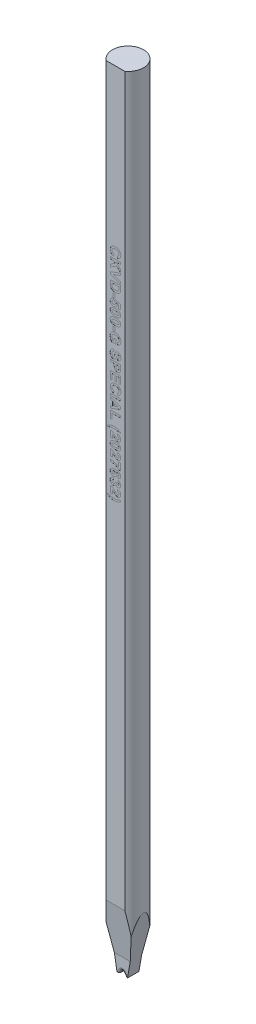
from build123d import *

# Parameters (mm, degrees)
SKETCH_TL_CUTTING_R       = 1.4986
TL_CUTTING_DEPTH          = 75.9968
SKETCH_TDF_GRINDING_W     = 3.0172
SKETCH_TDF_GRINDING_H     = 3.0172
TDF_GRINDING_DEPTH        = 77.026345527
SKETCH_ENGRAVING_W        = 0.166666667
SKETCH_ENGRAVING_H        = 0.371794872
SKETCH_ENGRAVING_W_2      = 1
SKETCH_ENGRAVING_H_2      = 0.192307693
ENGRAVING_DEPTH           = 0.005
VW_VR_GRINDING_DEPTH      = 1.5086
VW_VR_GRINDING_DEPTH_BACK = 1.5086
ISA_GRINDING_DEPTH        = 1.5086
ISA_GRINDING_DEPTH_BACK   = 1.5086
PRE_FRX_BRX_DEPTH         = 1.5086
PRE_FRX_BRX_DEPTH_BACK    = 1.5086
SKETCH_PRE_FRX_BRX_W      = 0.95742
SKETCH_PRE_FRX_BRX_H      = 1.4986
SKETCH_PRE_FRX_BRX_W_2    = 0.95996
FR_EDM_R                  = 0.24892
BR_EDM_R                  = 0.24892
FA_BA_GRINDING_DEPTH      = 1.5086
FA_BA_GRINDING_DEPTH_BACK = 1.5086


with BuildPart() as part:
    # sketch_TL_cutting → TL_cutting (new body)
    with BuildSketch(Plane(origin=(0, 0, 0), x_dir=(1, 0, 0), z_dir=(0, 1, 0))):
        Circle(SKETCH_TL_CUTTING_R)
    extrude(amount=TL_CUTTING_DEPTH)

    # sketch_TDF_grinding → TDF_grinding (cut, through all)
    with BuildSketch(Plane(origin=(0, 0, 0), x_dir=(1, 0, 0), z_dir=(0, 1, 0))):
        with Locations((0, -2.71002)):
            Rectangle(SKETCH_TDF_GRINDING_W, SKETCH_TDF_GRINDING_H)
    extrude(amount=TDF_GRINDING_DEPTH, mode=Mode.SUBTRACT)

    # sketch_engraving → engraving (cut)
    # profile 1 of 26: a face of its own
    with BuildSketch(Plane.XY.offset(1.20142)):
        with BuildLine():
            Line((-0.128205128, 60.253210256), (-0.192307692, 60.060902564))
            add(Edge.make_bspline(
                [(-0.192307692, 60.060902564), (-0.204917923, 60.064809052), (-0.229612721, 60.072459184), (-0.2649877, 60.086537804), (-0.297871332, 60.102532008), (-0.328259475, 60.120359875), (-0.356049464, 60.140095258), (-0.381471598, 60.161589244), (-0.404368127, 60.185053424), (-0.424673345, 60.210470624), (-0.442633936, 60.237563711), (-0.457816548, 60.266656053), (-0.470893242, 60.29731117), (-0.481488041, 60.329840557), (-0.489972889, 60.364028151), (-0.495577171, 60.400034413), (-0.499377062, 60.437690896), (-0.499789062, 60.463403283), (-0.5, 60.476567628)],
                knots=[0, 0, 0, 0, 1.126670901, 2.206376047, 3.246533763, 4.245677351, 5.210506282, 6.152793389, 7.083980095, 8.004497442, 8.926231833, 9.854395169, 10.801995143, 11.768203916, 12.771938831, 13.805609698, 14.87650608, 16, 16, 16, 16], degree=3))
            add(Edge.make_bspline(
                [(-0.5, 60.476567628), (-0.499663994, 60.492816309), (-0.499003061, 60.524777949), (-0.492350465, 60.571519052), (-0.481969511, 60.616060328), (-0.467601869, 60.658469613), (-0.448555271, 60.698448786), (-0.42571373, 60.736373108), (-0.398318662, 60.771809391), (-0.367249987, 60.804950716), (-0.332452821, 60.835079196), (-0.294134751, 60.861072297), (-0.253074131, 60.883610491), (-0.208709772, 60.901536594), (-0.161353037, 60.915621791), (-0.110975156, 60.925468328), (-0.057578507, 60.931634942), (-0.020984357, 60.932337083), (-0.002203526, 60.932697436)],
                knots=[0, 0, 0, 0, 1.025134988, 2.016471176, 2.973446247, 3.909197306, 4.836872559, 5.763618465, 6.698581235, 7.658772073, 8.627106982, 9.597494692, 10.576422683, 11.578339294, 12.6118974, 13.690673505, 14.814808564, 16, 16, 16, 16], degree=3))
            add(Edge.make_bspline(
                [(-0.002203526, 60.932697436), (0.017576475, 60.9323292), (0.056163648, 60.931610839), (0.112313555, 60.925562878), (0.165084042, 60.915516768), (0.214577853, 60.901940058), (0.260470573, 60.883729249), (0.303160692, 60.861873909), (0.342311169, 60.835756152), (0.377833814, 60.805831091), (0.409480853, 60.772697852), (0.437377469, 60.736993428), (0.460593243, 60.698491041), (0.479896446, 60.657667336), (0.494630503, 60.614223397), (0.505304611, 60.568276602), (0.511505561, 60.519806054), (0.512376199, 60.48666808), (0.512820513, 60.469756731)],
                knots=[0, 0, 0, 0, 1.212773307, 2.365899439, 3.458117515, 4.504331001, 5.50806732, 6.480562534, 7.440239902, 8.387651817, 9.323121479, 10.245404239, 11.160468186, 12.07454208, 13.009500751, 13.96802424, 14.963018902, 16, 16, 16, 16], degree=3))
            add(Edge.make_bspline(
                [(0.512820513, 60.469756731), (0.512448361, 60.454987276), (0.511718707, 60.426029796), (0.506761415, 60.383624506), (0.498061698, 60.343436158), (0.486319015, 60.305247521), (0.470821797, 60.269275987), (0.451884357, 60.235457111), (0.429606892, 60.203674651), (0.412205553, 60.184525065), (0.403445513, 60.174884936)],
                knots=[0, 0, 0, 0, 1.098510076, 2.153775193, 3.169777012, 4.153122333, 5.120892526, 6.076995459, 7.031936742, 8, 8, 8, 8], degree=3))
            add(Edge.make_bspline(
                [(0.403445513, 60.174884936), (0.39787141, 60.169297644), (0.386592274, 60.157991818), (0.367549896, 60.142895368), (0.347050772, 60.128582058), (0.324745215, 60.115279068), (0.30046466, 60.103406849), (0.274581981, 60.092394097), (0.246997406, 60.082255069), (0.227800247, 60.076616604), (0.217948718, 60.073723077)],
                knots=[0, 0, 0, 0, 0.885292881, 1.791380647, 2.722937556, 3.69093542, 4.703306561, 5.754477758, 6.847650944, 8, 8, 8, 8], degree=3))
            Line((0.217948718, 60.073723077), (0.179487179, 60.266030769))
            add(Edge.make_bspline(
                [(0.179487179, 60.266030769), (0.1857949, 60.267665288), (0.198219456, 60.270884861), (0.21607256, 60.27739955), (0.233014714, 60.284871208), (0.248625569, 60.2941361), (0.263619506, 60.303962074), (0.277222328, 60.315624773), (0.290109132, 60.328129754), (0.301694454, 60.342018861), (0.312145605, 60.356893589), (0.321339918, 60.372603983), (0.329014435, 60.389188478), (0.335156827, 60.406521754), (0.340319842, 60.424545702), (0.34350638, 60.443432147), (0.345953545, 60.463015752), (0.3460861, 60.476358875), (0.346153846, 60.483178205)],
                knots=[0, 0, 0, 0, 1.051114734, 2.070420253, 3.064047898, 4.034553068, 4.997066449, 5.953344811, 6.921213386, 7.892675544, 8.867420182, 9.852654213, 10.826683617, 11.811917648, 12.818610352, 13.848120519, 14.900229319, 16, 16, 16, 16], degree=3))
            add(Edge.make_bspline(
                [(0.346153846, 60.483178205), (0.345958725, 60.492542256), (0.345576529, 60.51088423), (0.341532101, 60.53761448), (0.335695112, 60.563055692), (0.326982094, 60.58711706), (0.315677399, 60.609731698), (0.302244603, 60.631228905), (0.286035184, 60.651060806), (0.26758257, 60.669699764), (0.246135655, 60.686407721), (0.221779967, 60.701110652), (0.194212535, 60.713304121), (0.163711493, 60.723204409), (0.130202077, 60.730996736), (0.093641969, 60.736561162), (0.054005962, 60.739638434), (0.026581025, 60.740133903), (0.012419872, 60.740389744)],
                knots=[0, 0, 0, 0, 0.93816214, 1.837638998, 2.704791736, 3.551915875, 4.396257554, 5.235807848, 6.087970119, 6.959042444, 7.860386085, 8.80649345, 9.804409709, 10.875695391, 12.017327537, 13.250155505, 14.580089023, 16, 16, 16, 16], degree=3))
            add(Edge.make_bspline(
                [(0.012419872, 60.740389744), (-0.002609028, 60.740136423), (-0.031567402, 60.739648312), (-0.073337178, 60.736571685), (-0.111754322, 60.730971705), (-0.14688701, 60.723282849), (-0.178713725, 60.713332973), (-0.207179389, 60.701159106), (-0.23231734, 60.686686701), (-0.254110839, 60.669938275), (-0.272831387, 60.651337256), (-0.288926796, 60.631387439), (-0.302688307, 60.610206524), (-0.314010391, 60.587667053), (-0.322575422, 60.563683298), (-0.328786932, 60.538452371), (-0.332735688, 60.511881695), (-0.333131326, 60.493675799), (-0.333333333, 60.484380128)],
                knots=[0, 0, 0, 0, 1.475208372, 2.842499301, 4.107722225, 5.282836115, 6.369007568, 7.375918121, 8.315702116, 9.208439171, 10.065831443, 10.90006451, 11.71996243, 12.54067204, 13.369972975, 14.214060185, 15.088124569, 16, 16, 16, 16], degree=3))
            add(Edge.make_bspline(
                [(-0.333333333, 60.484380128), (-0.333161634, 60.477497953), (-0.332824013, 60.463965176), (-0.330681155, 60.443962689), (-0.326591822, 60.42476438), (-0.321184418, 60.406276281), (-0.314399721, 60.388426559), (-0.305696319, 60.37148748), (-0.295693052, 60.355125777), (-0.283969989, 60.33968094), (-0.270808612, 60.324946156), (-0.255597341, 60.311507159), (-0.238701667, 60.299041373), (-0.220008678, 60.287706947), (-0.199678377, 60.27712516), (-0.177394008, 60.268122121), (-0.153515697, 60.259734984), (-0.136789345, 60.255423153), (-0.128205128, 60.253210256)],
                knots=[0, 0, 0, 0, 0.980177776, 1.927374078, 2.859849964, 3.771585772, 4.668674471, 5.574490016, 6.479656464, 7.396337719, 8.332153134, 9.288470092, 10.28125149, 11.318486971, 12.398724812, 13.541284404, 14.738150009, 16, 16, 16, 16], degree=3))
        make_face()
    # profile 2 of 26: a face of its own
    with BuildSketch(Plane.XY.offset(1.20142)):
        Polygon((-0.5, 59.894235897), (0.5, 59.894235897), (0.5, 59.701928205), (0.052283654, 59.701928205), (0.5, 59.280253526), (0.5, 59.016030769), (0.11338141, 59.395838462), (-0.5, 59.003210256), (-0.5, 59.259420192), (-0.035456731, 59.541671795), (-0.198517628, 59.701928205), (-0.5, 59.701928205), align=None)
    # profile 3 of 26: a face of its own
    with BuildSketch(Plane.XY.offset(1.20142)):
        Polygon((-0.5, 58.627008333), (0.5, 58.9968), (0.5, 58.793675), (-0.243589744, 58.528851282), (0.5, 58.265029167), (0.5, 58.060902564), (-0.5, 58.429291987), align=None)
    # profile 4 of 26: a face of its own
    with BuildSketch(Plane.XY.offset(1.20142)):
        with BuildLine():
            Line((0.5, 57.971158974), (0.5, 57.604372115))
            add(Edge.make_bspline(
                [(0.5, 57.604372115), (0.500005193, 57.594354571), (0.500015306, 57.574848084), (0.498840892, 57.546539066), (0.497659587, 57.520066494), (0.495294873, 57.495506352), (0.492816233, 57.472773432), (0.489678088, 57.451826942), (0.485656212, 57.432799202), (0.482484481, 57.420800319), (0.480969551, 57.415069231)],
                knots=[0, 0, 0, 0, 1.259756885, 2.453039283, 3.563158368, 4.591894114, 5.55549294, 6.43918076, 7.254497783, 8, 8, 8, 8], degree=3))
            add(Edge.make_bspline(
                [(0.480969551, 57.415069231), (0.478637325, 57.407900254), (0.474014881, 57.393691431), (0.465827813, 57.372838378), (0.455960096, 57.353004479), (0.445111978, 57.333729819), (0.432903728, 57.315457553), (0.419595761, 57.297742873), (0.404753223, 57.281109803), (0.383633179, 57.25957514), (0.35420815, 57.235150255), (0.315375005, 57.20931972), (0.272594656, 57.187582014), (0.234409605, 57.172390641), (0.20183843, 57.162346542), (0.175754603, 57.155778141), (0.148301213, 57.150106468), (0.119383738, 57.145856292), (0.08913491, 57.142194906), (0.057465542, 57.139567238), (0.024383276, 57.13826625), (0.001870575, 57.137974494), (-0.009615385, 57.137825641)],
                knots=[0, 0, 0, 0, 0.745431882, 1.477436776, 2.212739876, 2.934276521, 3.663147754, 4.384200836, 5.123377481, 5.865761747, 7.365547505, 8.894711587, 10.468722596, 12.101948761, 12.951987285, 13.837595333, 14.760899389, 15.722756883, 16.726861385, 17.773652936, 18.864119771, 20, 20, 20, 20], degree=3))
            add(Edge.make_bspline(
                [(-0.009615385, 57.137825641), (-0.0294616, 57.138217046), (-0.067834928, 57.13897384), (-0.123301552, 57.144571211), (-0.17465514, 57.153866648), (-0.206804138, 57.163577075), (-0.222355769, 57.168274359)],
                knots=[0, 0, 0, 0, 1.103491527, 2.133638164, 3.0971734, 4, 4, 4, 4], degree=3))
            add(Edge.make_bspline(
                [(-0.222355769, 57.168274359), (-0.231274521, 57.171448003), (-0.248819098, 57.177691057), (-0.274127236, 57.188615932), (-0.298211673, 57.200420337), (-0.321053432, 57.213202184), (-0.342549771, 57.227026052), (-0.362636394, 57.241943645), (-0.381577746, 57.257723731), (-0.393236239, 57.26915549), (-0.399038462, 57.274844872)],
                knots=[0, 0, 0, 0, 1.090884612, 2.145940218, 3.175104604, 4.181306866, 5.161203701, 6.118658341, 7.063689906, 8, 8, 8, 8], degree=3))
            add(Edge.make_bspline(
                [(-0.399038462, 57.274844872), (-0.407300305, 57.284131145), (-0.424264154, 57.303198431), (-0.445652736, 57.33654995), (-0.464086504, 57.374425276), (-0.473760833, 57.401739168), (-0.478766026, 57.415870513)],
                knots=[0, 0, 0, 0, 0.912008655, 1.872605891, 2.89935344, 4, 4, 4, 4], degree=3))
            add(Edge.make_bspline(
                [(-0.478766026, 57.415870513), (-0.4805228, 57.421590486), (-0.484168894, 57.433461996), (-0.488062998, 57.452285444), (-0.492165475, 57.472379947), (-0.49463687, 57.493977223), (-0.497243066, 57.516853081), (-0.498706299, 57.541189822), (-0.49974511, 57.566903081), (-0.499913777, 57.584539175), (-0.5, 57.593554808)],
                knots=[0, 0, 0, 0, 0.799129865, 1.658552685, 2.566799617, 3.538529252, 4.561352959, 5.643373779, 6.795284424, 8, 8, 8, 8], degree=3))
            Line((-0.5, 57.593554808), (-0.5, 57.971158974))
            Line((-0.5, 57.971158974), (0.5, 57.971158974))
        make_face()
        with BuildLine():
            Line((0.333333333, 57.778851282), (-0.333333333, 57.778851282))
            Line((-0.333333333, 57.778851282), (-0.333333333, 57.620598077))
            add(Edge.make_bspline(
                [(-0.333333333, 57.620598077), (-0.333276671, 57.61345336), (-0.333167574, 57.599697049), (-0.332847006, 57.579791316), (-0.331979167, 57.561498115), (-0.331080228, 57.544721614), (-0.329595022, 57.52950549), (-0.328134266, 57.515783535), (-0.326090699, 57.503632132), (-0.324477534, 57.496127127), (-0.323717949, 57.492593269)],
                knots=[0, 0, 0, 0, 1.333384787, 2.567275092, 3.714769766, 4.750907381, 5.701951617, 6.567520054, 7.325492842, 8, 8, 8, 8], degree=3))
            add(Edge.make_bspline(
                [(-0.323717949, 57.492593269), (-0.321509316, 57.484316575), (-0.317207482, 57.468195757), (-0.307617456, 57.445560499), (-0.296048139, 57.425078507), (-0.282136533, 57.40640677), (-0.26455548, 57.38957967), (-0.242070693, 57.375215683), (-0.215254411, 57.361922192), (-0.189584523, 57.352818806), (-0.16665678, 57.346284413), (-0.147412959, 57.341861165), (-0.126593091, 57.338365591), (-0.104279343, 57.335358942), (-0.080500412, 57.332929499), (-0.055170426, 57.331417784), (-0.028320392, 57.330386029), (-0.009883527, 57.330219161), (-0.000400641, 57.330133333)],
                knots=[0, 0, 0, 0, 1.038686998, 2.023088296, 2.974059649, 3.888265163, 4.839857954, 5.909819677, 7.113156087, 8.466843969, 9.20827164, 10.006482943, 10.861893492, 11.769681931, 12.739021491, 13.762258324, 14.849031541, 16, 16, 16, 16], degree=3))
            add(Edge.make_bspline(
                [(-0.000400641, 57.330133333), (0.009082275, 57.3302185), (0.027452469, 57.330383485), (0.054102292, 57.331413664), (0.079033415, 57.332916863), (0.102276578, 57.335363691), (0.123864169, 57.338323456), (0.143813574, 57.341860891), (0.161996804, 57.346254423), (0.183589283, 57.352807511), (0.207947697, 57.362644996), (0.23429421, 57.376471199), (0.2571147, 57.392736402), (0.276689574, 57.411091558), (0.29287817, 57.432178569), (0.306422028, 57.455549371), (0.316938162, 57.481680279), (0.321416742, 57.500269318), (0.323717949, 57.509820833)],
                knots=[0, 0, 0, 0, 1.118059345, 2.165891593, 3.144157881, 4.062285166, 4.920717571, 5.712910489, 6.449981617, 7.12489426, 8.371943983, 9.541298068, 10.624898781, 11.666293176, 12.69306237, 13.747704633, 14.842713931, 16, 16, 16, 16], degree=3))
            add(Edge.make_bspline(
                [(0.323717949, 57.509820833), (0.324486218, 57.513955143), (0.326177652, 57.523057311), (0.328151987, 57.538161571), (0.329628909, 57.555948179), (0.331099472, 57.576377116), (0.331977905, 57.599427064), (0.332859431, 57.625132571), (0.333166326, 57.653516851), (0.333276065, 57.673349207), (0.333333333, 57.683699038)],
                knots=[0, 0, 0, 0, 0.578739524, 1.274162912, 2.095457587, 3.035141998, 4.093102578, 5.270121571, 6.575369351, 8, 8, 8, 8], degree=3))
            Line((0.333333333, 57.683699038), (0.333333333, 57.778851282))
        make_face(mode=Mode.SUBTRACT)
    # profile 5 of 26: a face of its own
    with BuildSketch(Plane.XY.offset(1.20142)):
        with Locations((-0.147435898, 56.810902564)):
            Rectangle(SKETCH_ENGRAVING_W, SKETCH_ENGRAVING_H)
    # profile 6 of 26: a face of its own
    with BuildSketch(Plane.XY.offset(1.20142)):
        with BuildLine():
            Line((-0.213942308, 56.560902564), (-0.192307692, 56.394235897))
            add(Edge.make_bspline(
                [(-0.192307692, 56.394235897), (-0.203607347, 56.392386826), (-0.225366694, 56.388826133), (-0.255826929, 56.377863828), (-0.282470914, 56.362235917), (-0.305088238, 56.342561759), (-0.323334969, 56.320118846), (-0.336523954, 56.295449962), (-0.344692684, 56.269080099), (-0.34566455, 56.250796649), (-0.346153846, 56.241591667)],
                knots=[0, 0, 0, 0, 1.155217688, 2.224562036, 3.249849536, 4.259092678, 5.238040954, 6.15568152, 7.071459712, 8, 8, 8, 8], degree=3))
            add(Edge.make_bspline(
                [(-0.346153846, 56.241591667), (-0.346059894, 56.236243112), (-0.34587598, 56.225773234), (-0.34378776, 56.210344535), (-0.340396301, 56.19560521), (-0.335789422, 56.181418977), (-0.329745146, 56.167921981), (-0.322266898, 56.15509854), (-0.313608966, 56.14279075), (-0.303697677, 56.131155274), (-0.29215854, 56.12071258), (-0.27939506, 56.111438023), (-0.265101057, 56.103850338), (-0.249674797, 56.097308976), (-0.232663378, 56.092681315), (-0.214481969, 56.088969692), (-0.194883734, 56.087084068), (-0.18142672, 56.086727617), (-0.174479167, 56.08654359)],
                knots=[0, 0, 0, 0, 0.98109136, 1.920501424, 2.850996269, 3.75396817, 4.653607445, 5.559568228, 6.474190795, 7.412641135, 8.358186253, 9.324081521, 10.300185094, 11.322066343, 12.392681767, 13.529496655, 14.72453472, 16, 16, 16, 16], degree=3))
            add(Edge.make_bspline(
                [(-0.174479167, 56.08654359), (-0.167930185, 56.086647549), (-0.155273198, 56.086848469), (-0.136935362, 56.08871253), (-0.119798482, 56.091573852), (-0.103987864, 56.096125768), (-0.089209555, 56.101324403), (-0.075987454, 56.108333513), (-0.063746794, 56.116024163), (-0.053149329, 56.12539838), (-0.04378212, 56.135610732), (-0.035449479, 56.146493065), (-0.028416647, 56.158190594), (-0.022600846, 56.17059263), (-0.018105451, 56.183752809), (-0.015265585, 56.197699831), (-0.013079926, 56.212277064), (-0.012907894, 56.222285328), (-0.012820513, 56.22736891)],
                knots=[0, 0, 0, 0, 1.292262537, 2.497510385, 3.635136149, 4.715991128, 5.741845981, 6.720379908, 7.663568786, 8.58853187, 9.502632107, 10.396263742, 11.289117461, 12.191261909, 13.095714127, 14.026387781, 14.997526353, 16, 16, 16, 16], degree=3))
            add(Edge.make_bspline(
                [(-0.012820513, 56.22736891), (-0.013050924, 56.233795741), (-0.013510598, 56.24661737), (-0.017247301, 56.265544398), (-0.02333068, 56.28396685), (-0.031799166, 56.301865577), (-0.042720432, 56.319193226), (-0.056130694, 56.335874776), (-0.071799231, 56.352196575), (-0.083638008, 56.362222371), (-0.08974359, 56.367392949)],
                knots=[0, 0, 0, 0, 0.931687088, 1.85873035, 2.786835662, 3.740075265, 4.723687035, 5.750832598, 6.840042753, 8, 8, 8, 8], degree=3))
            Line((-0.08974359, 56.367392949), (-0.066105769, 56.535261538))
            Line((-0.066105769, 56.535261538), (0.487179487, 56.419876923))
            Line((0.487179487, 56.419876923), (0.487179487, 55.932697436))
            Line((0.487179487, 55.932697436), (0.294871795, 55.932697436))
            Line((0.294871795, 55.932697436), (0.294871795, 56.265630128))
            Line((0.294871795, 56.265630128), (0.116386218, 56.304892949))
            add(Edge.make_bspline(
                [(0.116386218, 56.304892949), (0.122158957, 56.294887656), (0.133400829, 56.275403282), (0.144973305, 56.24429635), (0.152400706, 56.213029621), (0.153366831, 56.191952487), (0.153846154, 56.181495513)],
                knots=[0, 0, 0, 0, 1.060051984, 2.064352337, 3.039669322, 4, 4, 4, 4], degree=3))
            add(Edge.make_bspline(
                [(0.153846154, 56.181495513), (0.153581613, 56.171665068), (0.153059042, 56.152246132), (0.148771515, 56.123766641), (0.141705229, 56.096449395), (0.131871753, 56.07020215), (0.118982632, 56.045212644), (0.103404168, 56.021265451), (0.084866032, 55.998706296), (0.063903438, 55.977292789), (0.04071085, 55.957765174), (0.015420507, 55.940901525), (-0.011337699, 55.926336215), (-0.039859413, 55.914478326), (-0.070184315, 55.905548996), (-0.102051282, 55.89886179), (-0.135661543, 55.895115665), (-0.158578281, 55.894533149), (-0.170272436, 55.894235897)],
                knots=[0, 0, 0, 0, 0.974409932, 1.924837087, 2.848242317, 3.768103797, 4.697919751, 5.630842317, 6.595644344, 7.588240789, 8.59876155, 9.595918743, 10.597287627, 11.615415169, 12.652315553, 13.727511434, 14.840374562, 16, 16, 16, 16], degree=3))
            add(Edge.make_bspline(
                [(-0.170272436, 55.894235897), (-0.180095164, 55.89450219), (-0.199591316, 55.895030727), (-0.228431015, 55.898174662), (-0.256480502, 55.903884756), (-0.283660862, 55.911692183), (-0.310181667, 55.92153598), (-0.335760069, 55.933779792), (-0.360613268, 55.948272719), (-0.376286294, 55.959479985), (-0.384214744, 55.965149359)],
                knots=[0, 0, 0, 0, 1.0275977, 2.039576086, 3.029943557, 4.018141221, 4.995043124, 5.985410594, 6.980887897, 8, 8, 8, 8], degree=3))
            add(Edge.make_bspline(
                [(-0.384214744, 55.965149359), (-0.39442561, 55.973410871), (-0.414521783, 55.989670487), (-0.440928765, 56.017512796), (-0.463196136, 56.047810934), (-0.481238657, 56.080534524), (-0.495700415, 56.115411763), (-0.505577236, 56.152807561), (-0.511741284, 56.19244131), (-0.51245553, 56.219666597), (-0.512820513, 56.233578846)],
                knots=[0, 0, 0, 0, 1.018155984, 2.003849412, 2.967446846, 3.927472908, 4.896208823, 5.888955604, 6.921246412, 8, 8, 8, 8], degree=3))
            add(Edge.make_bspline(
                [(-0.512820513, 56.233578846), (-0.51261689, 56.244807919), (-0.512219305, 56.266733296), (-0.508313832, 56.298846963), (-0.50189785, 56.329325845), (-0.493201931, 56.358314952), (-0.481586571, 56.385539005), (-0.467806969, 56.411332218), (-0.451267563, 56.435497806), (-0.432181131, 56.457893624), (-0.411081442, 56.478457914), (-0.387995531, 56.496800686), (-0.363308362, 56.51312086), (-0.336770788, 56.527107199), (-0.308568836, 56.539026858), (-0.278557994, 56.548517794), (-0.246938394, 56.556332152), (-0.225062746, 56.55936223), (-0.213942308, 56.560902564)],
                knots=[0, 0, 0, 0, 1.098896741, 2.145655864, 3.16104256, 4.145315902, 5.10323158, 6.053780891, 7.003858069, 7.963890296, 8.930045353, 9.883557002, 10.846278307, 11.82296847, 12.816080213, 13.83936887, 14.901647787, 16, 16, 16, 16], degree=3))
        make_face()
    # profile 7 of 26: a face of its own
    with BuildSketch(Plane.XY.offset(1.20142)):
        with BuildLine():
            add(Edge.make_bspline(
                [(0.5, 55.464748718), (0.49971384, 55.452844998), (0.499156721, 55.429669821), (0.494192381, 55.395907508), (0.486315205, 55.364154925), (0.474936732, 55.334405943), (0.460535804, 55.306509267), (0.442472771, 55.280857415), (0.421624591, 55.25685643), (0.405435577, 55.243000797), (0.397235577, 55.235982692)],
                knots=[0, 0, 0, 0, 1.098626248, 2.138899374, 3.143835643, 4.113754749, 5.073488057, 6.034745239, 7.004566348, 8, 8, 8, 8], degree=3))
            add(Edge.make_bspline(
                [(0.397235577, 55.235982692), (0.392013767, 55.231967993), (0.381356969, 55.223774695), (0.364136726, 55.21274029), (0.345869985, 55.202131685), (0.326116385, 55.192873442), (0.305221356, 55.184000078), (0.283126793, 55.175809313), (0.259707844, 55.16857695), (0.235071142, 55.162272124), (0.209179241, 55.156378627), (0.181968999, 55.151441398), (0.15350924, 55.147215972), (0.123831018, 55.143920738), (0.092992495, 55.140966339), (0.060842825, 55.139349757), (0.027454838, 55.138025267), (0.004742429, 55.137892949), (-0.006810897, 55.137825641)],
                knots=[0, 0, 0, 0, 0.746775751, 1.524038446, 2.317840886, 3.141016509, 3.996283186, 4.892488336, 5.812382473, 6.774967264, 7.776368117, 8.823659909, 9.910833035, 11.039122168, 12.210293276, 13.424012874, 14.68964937, 16, 16, 16, 16], degree=3))
            add(Edge.make_bspline(
                [(-0.006810897, 55.137825641), (-0.01836425, 55.137891934), (-0.041009977, 55.138021876), (-0.074330982, 55.139354693), (-0.106413621, 55.140967781), (-0.13725379, 55.143913853), (-0.166926114, 55.147240728), (-0.195353975, 55.151346272), (-0.22243919, 55.156664764), (-0.248289812, 55.162471418), (-0.27303117, 55.168736077), (-0.296407841, 55.1762899), (-0.318777777, 55.184150303), (-0.339699687, 55.193229898), (-0.359477735, 55.202820372), (-0.377930928, 55.213271112), (-0.395257891, 55.224428726), (-0.40597091, 55.232701289), (-0.411258013, 55.236783974)],
                knots=[0, 0, 0, 0, 1.308411734, 2.564617834, 3.776541518, 4.94597967, 6.0725993, 7.15816376, 8.197872509, 9.197791611, 10.158952087, 11.086962723, 11.979249638, 12.843171697, 13.668427753, 14.467630577, 15.243743175, 16, 16, 16, 16], degree=3))
            add(Edge.make_bspline(
                [(-0.411258013, 55.236783974), (-0.419387722, 55.243737875), (-0.435436162, 55.257465209), (-0.456111536, 55.281200465), (-0.473801555, 55.3068109), (-0.487914093, 55.334657064), (-0.499368982, 55.364261236), (-0.506993451, 55.396065546), (-0.511967929, 55.429735616), (-0.512532265, 55.452911213), (-0.512820513, 55.464748718)],
                knots=[0, 0, 0, 0, 0.991667276, 1.957599061, 2.911530233, 3.873218945, 4.847995157, 5.850445929, 6.902062539, 8, 8, 8, 8], degree=3))
            add(Edge.make_bspline(
                [(-0.512820513, 55.464748718), (-0.512476011, 55.476721133), (-0.511800941, 55.500181702), (-0.506449472, 55.534435149), (-0.497876451, 55.566994622), (-0.485636462, 55.597743234), (-0.469774335, 55.626636989), (-0.45076002, 55.653901616), (-0.427732542, 55.678943948), (-0.40629523, 55.698549361), (-0.386925042, 55.712892741), (-0.37086259, 55.723009036), (-0.353675124, 55.732785358), (-0.33482528, 55.741223499), (-0.314870578, 55.749548475), (-0.293380967, 55.756921787), (-0.270541238, 55.763426959), (-0.246455682, 55.769534901), (-0.220958398, 55.774628025), (-0.194124629, 55.779312952), (-0.165840258, 55.783004927), (-0.136262825, 55.786278243), (-0.105322509, 55.788582844), (-0.073069943, 55.790454475), (-0.039401887, 55.791392969), (-0.01649349, 55.791577608), (-0.004807692, 55.791671795)],
                knots=[0, 0, 0, 0, 1.257818097, 2.464759732, 3.634271214, 4.790227596, 5.933394726, 7.09190477, 8.274482889, 9.50191983, 10.139172818, 10.805000628, 11.49619854, 12.215266328, 12.973768034, 13.768328009, 14.601232062, 15.469317089, 16.379095881, 17.333267023, 18.331755967, 19.376479622, 20.460535752, 21.592206075, 22.771760786, 24, 24, 24, 24], degree=3))
            add(Edge.make_bspline(
                [(-0.004807692, 55.791671795), (0.006678925, 55.791606), (0.02919122, 55.791477052), (0.062378132, 55.790134948), (0.094328674, 55.788541634), (0.12509981, 55.78556902), (0.154640959, 55.782269515), (0.183004063, 55.778156894), (0.209982531, 55.772738814), (0.235876189, 55.767389743), (0.260431507, 55.760649782), (0.2837906, 55.753224475), (0.306110518, 55.745390136), (0.326924245, 55.736217854), (0.346659803, 55.726682898), (0.365109758, 55.716224838), (0.382437536, 55.705069066), (0.39315045, 55.696796265), (0.3984375, 55.692713462)],
                knots=[0, 0, 0, 0, 1.304443357, 2.556541329, 3.771813033, 4.936929721, 6.066661712, 7.147723817, 8.190304831, 9.191350322, 10.149780912, 11.080355239, 11.975107155, 12.834450748, 13.66198663, 14.463397305, 15.241653965, 16, 16, 16, 16], degree=3))
            add(Edge.make_bspline(
                [(0.3984375, 55.692713462), (0.406566428, 55.685759179), (0.422613323, 55.672031089), (0.443299998, 55.648301361), (0.460913987, 55.622719209), (0.475197493, 55.594954301), (0.486497465, 55.565282107), (0.494183265, 55.533436121), (0.499144648, 55.499760686), (0.499710816, 55.476585839), (0.5, 55.464748718)],
                knots=[0, 0, 0, 0, 0.991631672, 1.957528776, 2.911425699, 3.867574088, 4.848108326, 5.850523106, 6.902101959, 8, 8, 8, 8], degree=3))
        make_face()
        with BuildLine():
            add(Edge.make_bspline(
                [(0.333333333, 55.464748718), (0.333068079, 55.470916684), (0.332548986, 55.482987158), (0.328316127, 55.500542094), (0.321759633, 55.517123165), (0.312130705, 55.532681206), (0.299093083, 55.54708978), (0.281476094, 55.559297658), (0.259881539, 55.569851162), (0.243736, 55.575130771), (0.235176282, 55.577929808)],
                knots=[0, 0, 0, 0, 0.909107913, 1.77908945, 2.650019014, 3.530482969, 4.465025013, 5.495890128, 6.672421267, 8, 8, 8, 8], degree=3))
            add(Edge.make_bspline(
                [(0.235176282, 55.577929808), (0.228718042, 55.579677997), (0.214837576, 55.583435317), (0.192206647, 55.58769972), (0.166522939, 55.591216485), (0.137792419, 55.594186038), (0.105999886, 55.596602628), (0.071125109, 55.598090848), (0.033192525, 55.599119478), (0.006878451, 55.599280391), (-0.006810897, 55.599364103)],
                knots=[0, 0, 0, 0, 0.658986521, 1.416336438, 2.266694271, 3.212608458, 4.261595115, 5.407496572, 6.651304179, 8, 8, 8, 8], degree=3))
            add(Edge.make_bspline(
                [(-0.006810897, 55.599364103), (-0.020433943, 55.599373117), (-0.046549094, 55.599390397), (-0.084006477, 55.598216163), (-0.118154033, 55.59704872), (-0.148991056, 55.594679061), (-0.176626244, 55.592340892), (-0.200847568, 55.588803343), (-0.221857789, 55.585250608), (-0.244486895, 55.579217153), (-0.268257705, 55.570901394), (-0.292448985, 55.559672977), (-0.311537375, 55.547007058), (-0.325415776, 55.532475587), (-0.334597404, 55.516730329), (-0.341538269, 55.500426395), (-0.345246665, 55.482874555), (-0.345848983, 55.470840013), (-0.346153846, 55.464748718)],
                knots=[0, 0, 0, 0, 1.613038927, 3.092168624, 4.43749063, 5.658264602, 6.75425577, 7.720394221, 8.556328411, 9.275513998, 10.490872946, 11.534172084, 12.42681833, 13.187531851, 13.88996177, 14.574222125, 15.278341114, 16, 16, 16, 16], degree=3))
            add(Edge.make_bspline(
                [(-0.346153846, 55.464748718), (-0.345874419, 55.45865088), (-0.345321688, 55.446588799), (-0.341225408, 55.429056833), (-0.334465655, 55.412499336), (-0.325029126, 55.396836493), (-0.311901617, 55.38241441), (-0.294300445, 55.370197614), (-0.272700888, 55.35964693), (-0.25655611, 55.354366893), (-0.247996795, 55.351567628)],
                knots=[0, 0, 0, 0, 0.899391665, 1.779078861, 2.640979247, 3.529945348, 4.464599804, 5.495588918, 6.672261578, 8, 8, 8, 8], degree=3))
            add(Edge.make_bspline(
                [(-0.247996795, 55.351567628), (-0.241538043, 55.349821968), (-0.227719754, 55.346087186), (-0.205229709, 55.341792396), (-0.179679092, 55.33826611), (-0.151079269, 55.335324791), (-0.11935541, 55.332884431), (-0.084546407, 55.331408845), (-0.046680798, 55.330379247), (-0.020433482, 55.330217356), (-0.006810897, 55.330133333)],
                knots=[0, 0, 0, 0, 0.66114423, 1.414496391, 2.261103113, 3.210114492, 4.255954433, 5.405607896, 6.653488082, 8, 8, 8, 8], degree=3))
            add(Edge.make_bspline(
                [(-0.006810897, 55.330133333), (0.006810741, 55.330247109), (0.032921137, 55.330465199), (0.070464093, 55.331092091), (0.104645163, 55.332847006), (0.13553417, 55.334603226), (0.163028833, 55.337568631), (0.187277888, 55.340511537), (0.208178651, 55.344583667), (0.23096624, 55.350175697), (0.254848985, 55.35851368), (0.278913284, 55.37008584), (0.298191428, 55.38252291), (0.312146257, 55.397029879), (0.321683592, 55.412748044), (0.328364426, 55.429200374), (0.332523972, 55.446649531), (0.333060584, 55.45864941), (0.333333333, 55.464748718)],
                knots=[0, 0, 0, 0, 1.611458614, 3.088895909, 4.441089836, 5.660086535, 6.747875232, 7.711965119, 8.548505902, 9.26500436, 10.486583113, 11.532259092, 12.419544583, 13.184925779, 13.890764661, 14.581638641, 15.279074115, 16, 16, 16, 16], degree=3))
        make_face(mode=Mode.SUBTRACT)
    # profile 8 of 26: a face of its own
    with BuildSketch(Plane.XY.offset(1.20142)):
        with BuildLine():
            add(Edge.make_bspline(
                [(0.5, 54.695517949), (0.49971384, 54.683614229), (0.499156721, 54.660439051), (0.494192381, 54.626676739), (0.486315205, 54.594924156), (0.474936732, 54.565175173), (0.460535804, 54.537278497), (0.442472771, 54.511626646), (0.421624591, 54.487625661), (0.405435577, 54.473770028), (0.397235577, 54.466751923)],
                knots=[0, 0, 0, 0, 1.098626248, 2.138899374, 3.143835643, 4.113754749, 5.073488057, 6.034745239, 7.004566348, 8, 8, 8, 8], degree=3))
            add(Edge.make_bspline(
                [(0.397235577, 54.466751923), (0.392013767, 54.462737224), (0.381356969, 54.454543926), (0.364136726, 54.44350952), (0.345869985, 54.432900915), (0.326116385, 54.423642673), (0.305221356, 54.414769309), (0.283126793, 54.406578544), (0.259707844, 54.39934618), (0.235071142, 54.393041354), (0.209179241, 54.387147858), (0.181968999, 54.382210628), (0.15350924, 54.377985203), (0.123831018, 54.374689969), (0.092992495, 54.37173557), (0.060842825, 54.370118988), (0.027454838, 54.368794498), (0.004742429, 54.368662179), (-0.006810897, 54.368594872)],
                knots=[0, 0, 0, 0, 0.746775751, 1.524038446, 2.317840886, 3.141016509, 3.996283186, 4.892488336, 5.812382473, 6.774967264, 7.776368117, 8.823659909, 9.910833035, 11.039122168, 12.210293276, 13.424012874, 14.68964937, 16, 16, 16, 16], degree=3))
            add(Edge.make_bspline(
                [(-0.006810897, 54.368594872), (-0.01836425, 54.368661165), (-0.041009977, 54.368791107), (-0.074330982, 54.370123924), (-0.106413621, 54.371737012), (-0.13725379, 54.374683084), (-0.166926114, 54.378009959), (-0.195353975, 54.382115503), (-0.22243919, 54.387433995), (-0.248289812, 54.393240649), (-0.27303117, 54.399505308), (-0.296407841, 54.407059131), (-0.318777777, 54.414919533), (-0.339699687, 54.423999129), (-0.359477735, 54.433589602), (-0.377930928, 54.444040342), (-0.395257891, 54.455197957), (-0.40597091, 54.46347052), (-0.411258013, 54.467553205)],
                knots=[0, 0, 0, 0, 1.308411734, 2.564617834, 3.776541518, 4.94597967, 6.0725993, 7.15816376, 8.197872509, 9.197791611, 10.158952087, 11.086962723, 11.979249638, 12.843171697, 13.668427753, 14.467630577, 15.243743175, 16, 16, 16, 16], degree=3))
            add(Edge.make_bspline(
                [(-0.411258013, 54.467553205), (-0.419387722, 54.474507105), (-0.435436162, 54.48823444), (-0.456111536, 54.511969695), (-0.473801555, 54.537580131), (-0.487914093, 54.565426295), (-0.499368982, 54.595030467), (-0.506993451, 54.626834777), (-0.511967929, 54.660504847), (-0.512532265, 54.683680444), (-0.512820513, 54.695517949)],
                knots=[0, 0, 0, 0, 0.991667276, 1.957599061, 2.911530233, 3.873218945, 4.847995157, 5.850445929, 6.902062539, 8, 8, 8, 8], degree=3))
            add(Edge.make_bspline(
                [(-0.512820513, 54.695517949), (-0.512476011, 54.707490364), (-0.511800941, 54.730950933), (-0.506449472, 54.765204379), (-0.497876451, 54.797763853), (-0.485636462, 54.828512465), (-0.469774335, 54.85740622), (-0.45076002, 54.884670847), (-0.427732542, 54.909713179), (-0.40629523, 54.929318592), (-0.386925042, 54.943661971), (-0.37086259, 54.953778267), (-0.353675124, 54.963554589), (-0.33482528, 54.97199273), (-0.314870578, 54.980317706), (-0.293380967, 54.987691018), (-0.270541238, 54.99419619), (-0.246455682, 55.000304132), (-0.220958398, 55.005397256), (-0.194124629, 55.010082183), (-0.165840258, 55.013774157), (-0.136262825, 55.017047473), (-0.105322509, 55.019352075), (-0.073069943, 55.021223706), (-0.039401887, 55.0221622), (-0.01649349, 55.022346839), (-0.004807692, 55.022441026)],
                knots=[0, 0, 0, 0, 1.257818097, 2.464759732, 3.634271214, 4.790227596, 5.933394726, 7.09190477, 8.274482889, 9.50191983, 10.139172818, 10.805000628, 11.49619854, 12.215266328, 12.973768034, 13.768328009, 14.601232062, 15.469317089, 16.379095881, 17.333267023, 18.331755967, 19.376479622, 20.460535752, 21.592206075, 22.771760786, 24, 24, 24, 24], degree=3))
            add(Edge.make_bspline(
                [(-0.004807692, 55.022441026), (0.006678925, 55.022375231), (0.02919122, 55.022246282), (0.062378132, 55.020904179), (0.094328674, 55.019310865), (0.12509981, 55.016338251), (0.154640959, 55.013038746), (0.183004063, 55.008926125), (0.209982531, 55.003508045), (0.235876189, 54.998158974), (0.260431507, 54.991419013), (0.2837906, 54.983993706), (0.306110518, 54.976159367), (0.326924245, 54.966987084), (0.346659803, 54.957452128), (0.365109758, 54.946994069), (0.382437536, 54.935838297), (0.39315045, 54.927565495), (0.3984375, 54.923482692)],
                knots=[0, 0, 0, 0, 1.304443357, 2.556541329, 3.771813033, 4.936929721, 6.066661712, 7.147723817, 8.190304831, 9.191350322, 10.149780912, 11.080355239, 11.975107155, 12.834450748, 13.66198663, 14.463397305, 15.241653965, 16, 16, 16, 16], degree=3))
            add(Edge.make_bspline(
                [(0.3984375, 54.923482692), (0.406566428, 54.91652841), (0.422613323, 54.90280032), (0.443299998, 54.879070592), (0.460913987, 54.853488439), (0.475197493, 54.825723532), (0.486497465, 54.796051338), (0.494183265, 54.764205352), (0.499144648, 54.730529916), (0.499710816, 54.70735507), (0.5, 54.695517949)],
                knots=[0, 0, 0, 0, 0.991631672, 1.957528776, 2.911425699, 3.867574088, 4.848108326, 5.850523106, 6.902101959, 8, 8, 8, 8], degree=3))
        make_face()
        with BuildLine():
            add(Edge.make_bspline(
                [(0.333333333, 54.695517949), (0.333068079, 54.701685915), (0.332548986, 54.713756389), (0.328316127, 54.731311325), (0.321759633, 54.747892396), (0.312130705, 54.763450436), (0.299093083, 54.777859011), (0.281476094, 54.790066888), (0.259881539, 54.800620392), (0.243736, 54.805900001), (0.235176282, 54.808699038)],
                knots=[0, 0, 0, 0, 0.909107913, 1.77908945, 2.650019014, 3.530482969, 4.465025013, 5.495890128, 6.672421267, 8, 8, 8, 8], degree=3))
            add(Edge.make_bspline(
                [(0.235176282, 54.808699038), (0.228718042, 54.810447227), (0.214837576, 54.814204548), (0.192206647, 54.818468951), (0.166522939, 54.821985716), (0.137792419, 54.824955269), (0.105999886, 54.827371859), (0.071125109, 54.828860078), (0.033192525, 54.829888709), (0.006878451, 54.830049622), (-0.006810897, 54.830133333)],
                knots=[0, 0, 0, 0, 0.658986521, 1.416336438, 2.266694271, 3.212608458, 4.261595115, 5.407496572, 6.651304179, 8, 8, 8, 8], degree=3))
            add(Edge.make_bspline(
                [(-0.006810897, 54.830133333), (-0.020433943, 54.830142347), (-0.046549094, 54.830159627), (-0.084006477, 54.828985394), (-0.118154033, 54.827817951), (-0.148991056, 54.825448292), (-0.176626244, 54.823110123), (-0.200847568, 54.819572574), (-0.221857789, 54.816019839), (-0.244486895, 54.809986384), (-0.268257705, 54.801670625), (-0.292448985, 54.790442207), (-0.311537375, 54.777776289), (-0.325415776, 54.763244818), (-0.334597404, 54.74749956), (-0.341538269, 54.731195625), (-0.345246665, 54.713643786), (-0.345848983, 54.701609244), (-0.346153846, 54.695517949)],
                knots=[0, 0, 0, 0, 1.613038927, 3.092168624, 4.43749063, 5.658264602, 6.75425577, 7.720394221, 8.556328411, 9.275513998, 10.490872946, 11.534172084, 12.42681833, 13.187531851, 13.88996177, 14.574222125, 15.278341114, 16, 16, 16, 16], degree=3))
            add(Edge.make_bspline(
                [(-0.346153846, 54.695517949), (-0.345874419, 54.689420111), (-0.345321688, 54.67735803), (-0.341225408, 54.659826063), (-0.334465655, 54.643268567), (-0.325029126, 54.627605723), (-0.311901617, 54.613183641), (-0.294300445, 54.600966845), (-0.272700888, 54.590416161), (-0.25655611, 54.585136123), (-0.247996795, 54.582336859)],
                knots=[0, 0, 0, 0, 0.899391665, 1.779078861, 2.640979247, 3.529945348, 4.464599804, 5.495588918, 6.672261578, 8, 8, 8, 8], degree=3))
            add(Edge.make_bspline(
                [(-0.247996795, 54.582336859), (-0.241538043, 54.580591199), (-0.227719754, 54.576856417), (-0.205229709, 54.572561627), (-0.179679092, 54.56903534), (-0.151079269, 54.566094022), (-0.11935541, 54.563653662), (-0.084546407, 54.562178076), (-0.046680798, 54.561148478), (-0.020433482, 54.560986587), (-0.006810897, 54.560902564)],
                knots=[0, 0, 0, 0, 0.66114423, 1.414496391, 2.261103113, 3.210114492, 4.255954433, 5.405607896, 6.653488082, 8, 8, 8, 8], degree=3))
            add(Edge.make_bspline(
                [(-0.006810897, 54.560902564), (0.006810741, 54.56101634), (0.032921137, 54.56123443), (0.070464093, 54.561861322), (0.104645163, 54.563616237), (0.13553417, 54.565372457), (0.163028833, 54.568337861), (0.187277888, 54.571280768), (0.208178651, 54.575352897), (0.23096624, 54.580944928), (0.254848985, 54.58928291), (0.278913284, 54.600855071), (0.298191428, 54.613292141), (0.312146257, 54.62779911), (0.321683592, 54.643517274), (0.328364426, 54.659969605), (0.332523972, 54.677418762), (0.333060584, 54.689418641), (0.333333333, 54.695517949)],
                knots=[0, 0, 0, 0, 1.611458614, 3.088895909, 4.441089836, 5.660086535, 6.747875232, 7.711965119, 8.548505902, 9.26500436, 10.486583113, 11.532259092, 12.419544583, 13.184925779, 13.890764661, 14.581638641, 15.279074115, 16, 16, 16, 16], degree=3))
        make_face(mode=Mode.SUBTRACT)
    # profile 9 of 26: a face of its own
    with BuildSketch(Plane.XY.offset(1.20142)):
        with Locations((-0.147435898, 54.041671795)):
            Rectangle(SKETCH_ENGRAVING_W, SKETCH_ENGRAVING_H)
    # profile 10 of 26: a face of its own
    with BuildSketch(Plane.XY.offset(1.20142)):
        with BuildLine():
            Line((-0.128205128, 53.291671795), (0.038461538, 53.291671795))
            Line((0.038461538, 53.291671795), (0.038461538, 52.855774359))
            Line((0.038461538, 52.855774359), (-0.36338141, 52.855774359))
            add(Edge.make_bspline(
                [(-0.36338141, 52.855774359), (-0.368321434, 52.861260375), (-0.378419843, 52.8724749), (-0.392661125, 52.890772664), (-0.406257259, 52.910916779), (-0.4194836, 52.932785469), (-0.432233696, 52.956423992), (-0.444685123, 52.981738064), (-0.45671611, 53.008774391), (-0.471787381, 53.047007711), (-0.488186169, 53.09622183), (-0.502445448, 53.156387076), (-0.511191227, 53.217028267), (-0.512277771, 53.257589075), (-0.512820513, 53.277849679)],
                knots=[0, 0, 0, 0, 0.581799769, 1.189316438, 1.825828404, 2.496525428, 3.203088405, 3.942228803, 4.719818701, 5.534979611, 7.181138583, 8.803804008, 10.403462225, 12, 12, 12, 12], degree=3))
            add(Edge.make_bspline(
                [(-0.512820513, 53.277849679), (-0.512629241, 53.290542166), (-0.512252188, 53.315562831), (-0.509233571, 53.352501118), (-0.504017902, 53.388218224), (-0.496780719, 53.422650736), (-0.487836372, 53.455901646), (-0.476607913, 53.487854166), (-0.463065488, 53.518474068), (-0.447986133, 53.547990581), (-0.430657849, 53.575843177), (-0.411724289, 53.602087023), (-0.390891397, 53.626467404), (-0.36853351, 53.649196217), (-0.344060025, 53.669844803), (-0.318106216, 53.688926641), (-0.290219674, 53.705985038), (-0.260879177, 53.721311559), (-0.230317098, 53.734940942), (-0.198781008, 53.746443246), (-0.166726875, 53.756526922), (-0.134042675, 53.764814707), (-0.10062201, 53.770901654), (-0.066619552, 53.775633529), (-0.031822841, 53.778175004), (-0.008417054, 53.778624325), (0.003405449, 53.778851282)],
                knots=[0, 0, 0, 0, 1.124897971, 2.217508473, 3.282174662, 4.322209414, 5.334422951, 6.332119154, 7.320662553, 8.300074908, 9.267468154, 10.225199689, 11.165658754, 12.107290334, 13.047749399, 14.00069605, 14.959944213, 15.942088746, 16.933021067, 17.923599838, 18.915715637, 19.910475908, 20.909926025, 21.925232038, 22.952013513, 24, 24, 24, 24], degree=3))
            add(Edge.make_bspline(
                [(0.003405449, 53.778851282), (0.016165747, 53.778667383), (0.041321811, 53.778304838), (0.078501182, 53.775175194), (0.114594914, 53.770327239), (0.149519517, 53.762932247), (0.183523729, 53.754078796), (0.216299841, 53.742734109), (0.248180515, 53.729780661), (0.278688999, 53.714496543), (0.308028284, 53.697613971), (0.335510174, 53.6784304), (0.361403632, 53.6576108), (0.385591047, 53.634967968), (0.407627145, 53.610129007), (0.428063784, 53.583603308), (0.447146094, 53.55540846), (0.457908016, 53.535231736), (0.463341346, 53.525045192)],
                knots=[0, 0, 0, 0, 1.105132952, 2.178694671, 3.229818344, 4.257558797, 5.269123684, 6.27148554, 7.259679084, 8.247804916, 9.224967877, 10.189258471, 11.147685264, 12.101072275, 13.055511435, 14.02039165, 15.000562851, 16, 16, 16, 16], degree=3))
            add(Edge.make_bspline(
                [(0.463341346, 53.525045192), (0.467347168, 53.516957841), (0.475455657, 53.500587618), (0.485329628, 53.474514525), (0.494054347, 53.447146948), (0.500719187, 53.418165473), (0.506115234, 53.387878993), (0.510216979, 53.356137917), (0.512307439, 53.322883708), (0.512647258, 53.300221284), (0.512820513, 53.288666987)],
                knots=[0, 0, 0, 0, 0.887950456, 1.797368171, 2.741221183, 3.713797788, 4.722103116, 5.768966405, 6.862521341, 8, 8, 8, 8], degree=3))
            add(Edge.make_bspline(
                [(0.512820513, 53.288666987), (0.512598613, 53.273769487), (0.512167059, 53.244796604), (0.508571106, 53.20255631), (0.502373597, 53.162802674), (0.493837942, 53.125480334), (0.482863355, 53.090669697), (0.469371425, 53.058430687), (0.453633675, 53.028565429), (0.435019378, 53.001506485), (0.414494937, 52.976703918), (0.392035387, 52.954222449), (0.367607461, 52.934053031), (0.341334074, 52.916182318), (0.313106625, 52.900750967), (0.283182558, 52.887482952), (0.251334696, 52.876561769), (0.22921692, 52.871283803), (0.217948718, 52.868594872)],
                knots=[0, 0, 0, 0, 1.271135529, 2.472123572, 3.614091059, 4.701890498, 5.736279567, 6.724681829, 7.680621489, 8.611506429, 9.52200816, 10.424540711, 11.318996785, 12.221421405, 13.131851814, 14.060431888, 15.011860567, 16, 16, 16, 16], degree=3))
            Line((0.217948718, 52.868594872), (0.179487179, 53.060902564))
            add(Edge.make_bspline(
                [(0.179487179, 53.060902564), (0.185798707, 53.062805146), (0.198251232, 53.066558905), (0.216108293, 53.073865481), (0.232994438, 53.082183603), (0.248643132, 53.092010597), (0.263649233, 53.102448251), (0.277161531, 53.114718435), (0.290187329, 53.127625453), (0.301701762, 53.142116609), (0.312086782, 53.157555164), (0.321450083, 53.173776632), (0.329043783, 53.191144974), (0.335153652, 53.209417597), (0.340342569, 53.228505002), (0.343533767, 53.24865634), (0.345940549, 53.2696453), (0.346081986, 53.283985325), (0.346153846, 53.291271154)],
                knots=[0, 0, 0, 0, 1.027780279, 2.027791312, 3.006028774, 3.96000864, 4.908113241, 5.852721087, 6.802883308, 7.765918715, 8.733730415, 9.704005314, 10.683351261, 11.68471758, 12.707948499, 13.764514378, 14.864202456, 16, 16, 16, 16], degree=3))
            add(Edge.make_bspline(
                [(0.346153846, 53.291271154), (0.345859633, 53.302298511), (0.34528545, 53.323819337), (0.341538784, 53.355236876), (0.334873123, 53.384876442), (0.325679114, 53.41281554), (0.313877959, 53.439105391), (0.299029501, 53.463390737), (0.282012344, 53.48627627), (0.262039987, 53.507110747), (0.239645267, 53.52600525), (0.214561065, 53.542361822), (0.186868462, 53.555978599), (0.156706511, 53.567131515), (0.124073954, 53.576011616), (0.088855272, 53.582035764), (0.051104495, 53.585971833), (0.02505068, 53.586349093), (0.01161859, 53.58654359)],
                knots=[0, 0, 0, 0, 1.043810997, 2.037086103, 2.989314757, 3.91471467, 4.817033861, 5.710208705, 6.603920097, 7.511448416, 8.435617211, 9.371747005, 10.338444094, 11.350425613, 12.411431869, 13.5347293, 14.729025275, 16, 16, 16, 16], degree=3))
            add(Edge.make_bspline(
                [(0.01161859, 53.58654359), (-0.002813331, 53.586340916), (-0.03086261, 53.585947007), (-0.071503034, 53.582112106), (-0.109371212, 53.575813885), (-0.14440027, 53.566746527), (-0.176807311, 53.555439264), (-0.206438048, 53.541459735), (-0.233109204, 53.524651899), (-0.256980675, 53.505589064), (-0.278169336, 53.484552253), (-0.296147735, 53.461489293), (-0.31184176, 53.437231086), (-0.32420794, 53.411091286), (-0.33413508, 53.383542798), (-0.341078682, 53.354316769), (-0.345395871, 53.323518498), (-0.345897627, 53.302436945), (-0.346153846, 53.291671795)],
                knots=[0, 0, 0, 0, 1.31821493, 2.562027667, 3.72541598, 4.821825939, 5.863743127, 6.857000185, 7.808227391, 8.737146514, 9.643023621, 10.529087527, 11.404035307, 12.277173472, 13.164790074, 14.074766194, 15.016892606, 16, 16, 16, 16], degree=3))
            add(Edge.make_bspline(
                [(-0.346153846, 53.291671795), (-0.345850315, 53.280768504), (-0.34524035, 53.258857617), (-0.340086045, 53.226036537), (-0.332449955, 53.193036283), (-0.321065283, 53.160643933), (-0.307937779, 53.129257225), (-0.292687307, 53.100091024), (-0.276962331, 53.072698447), (-0.264654274, 53.056185969), (-0.258613782, 53.048082051)],
                knots=[0, 0, 0, 0, 0.993779204, 1.997065276, 3.023588959, 4.078879359, 5.123947549, 6.123456565, 7.079038607, 8, 8, 8, 8], degree=3))
            Line((-0.258613782, 53.048082051), (-0.128205128, 53.048082051))
            Line((-0.128205128, 53.048082051), (-0.128205128, 53.291671795))
        make_face()
    # profile 11 of 26: a face of its own
    with BuildSketch(Plane.XY.offset(1.20142)):
        with BuildLine():
            Line((-0.166666667, 52.330133333), (-0.153846154, 52.137825641))
            add(Edge.make_bspline(
                [(-0.153846154, 52.137825641), (-0.161891279, 52.136292992), (-0.177518424, 52.133315918), (-0.199795017, 52.126712009), (-0.220541784, 52.119405841), (-0.239662803, 52.110792964), (-0.25710555, 52.100927896), (-0.273156714, 52.090137618), (-0.28732832, 52.077894862), (-0.299925293, 52.064563176), (-0.310783278, 52.049989999), (-0.320246275, 52.034289399), (-0.328256178, 52.017368131), (-0.334922245, 51.999290819), (-0.339885492, 51.979877406), (-0.343420115, 51.959309762), (-0.345682646, 51.937554761), (-0.345994208, 51.922687096), (-0.346153846, 51.915069231)],
                knots=[0, 0, 0, 0, 1.20477517, 2.340199137, 3.415898527, 4.440826703, 5.422227366, 6.362763262, 7.28278988, 8.172822029, 9.057410505, 9.952475558, 10.866920142, 11.809098, 12.784128911, 13.811833846, 14.878831738, 16, 16, 16, 16], degree=3))
            add(Edge.make_bspline(
                [(-0.346153846, 51.915069231), (-0.346066367, 51.907050933), (-0.345896216, 51.891454929), (-0.343785338, 51.868854596), (-0.340761278, 51.847722259), (-0.335974263, 51.828244522), (-0.330620744, 51.810057658), (-0.323296559, 51.793613353), (-0.314849171, 51.778645499), (-0.305263574, 51.765192657), (-0.294632459, 51.753452348), (-0.28353392, 51.743181341), (-0.272207737, 51.734235972), (-0.260151301, 51.727195334), (-0.247852227, 51.721497439), (-0.234943611, 51.71773153), (-0.221721863, 51.715187435), (-0.212685699, 51.714895702), (-0.208133013, 51.714748718)],
                knots=[0, 0, 0, 0, 1.417779877, 2.757654889, 4.012140507, 5.189587551, 6.302846416, 7.360586765, 8.365575446, 9.33904572, 10.275781718, 11.161696098, 12.012180333, 12.822428111, 13.625933072, 14.403138519, 15.195454004, 16, 16, 16, 16], degree=3))
            add(Edge.make_bspline(
                [(-0.208133013, 51.714748718), (-0.202439146, 51.715042996), (-0.191320796, 51.715617629), (-0.175220679, 51.719387928), (-0.160658688, 51.726192431), (-0.147071392, 51.735428971), (-0.134926522, 51.748393369), (-0.123459543, 51.764797524), (-0.11316916, 51.785257237), (-0.107424402, 51.800425842), (-0.104366987, 51.808498718)],
                knots=[0, 0, 0, 0, 0.906150226, 1.7694295, 2.610923838, 3.450874087, 4.367551936, 5.419872502, 6.626831617, 8, 8, 8, 8], degree=3))
            add(Edge.make_bspline(
                [(-0.104366987, 51.808498718), (-0.103205903, 51.811962905), (-0.100607587, 51.819715194), (-0.096897182, 51.832941154), (-0.092218385, 51.848926556), (-0.087052561, 51.867819979), (-0.081545375, 51.889582885), (-0.074955523, 51.914008532), (-0.068334023, 51.941467832), (-0.063456004, 51.960680895), (-0.060897436, 51.970758333)],
                knots=[0, 0, 0, 0, 0.521824192, 1.167757792, 1.961731518, 2.901193269, 3.965386864, 5.168422915, 6.514810244, 8, 8, 8, 8], degree=3))
            add(Edge.make_bspline(
                [(-0.060897436, 51.970758333), (-0.0576208, 51.983881849), (-0.051299067, 52.009201528), (-0.040053153, 52.045313187), (-0.028879714, 52.078572685), (-0.016755933, 52.108659788), (-0.004503472, 52.135906368), (0.008737874, 52.159871704), (0.022280434, 52.1810559), (0.032402475, 52.193400422), (0.037259615, 52.199324038)],
                knots=[0, 0, 0, 0, 1.293880989, 2.496331788, 3.617634808, 4.64976062, 5.598842568, 6.473791081, 7.267636666, 8, 8, 8, 8], degree=3))
            add(Edge.make_bspline(
                [(0.037259615, 52.199324038), (0.044137694, 52.206670092), (0.057622804, 52.221072711), (0.079781426, 52.240031522), (0.103188466, 52.255962086), (0.127671148, 52.269074684), (0.153370416, 52.279171137), (0.180114252, 52.286327373), (0.207972454, 52.290959148), (0.22694455, 52.291431789), (0.236578526, 52.291671795)],
                knots=[0, 0, 0, 0, 1.064429417, 2.086912298, 3.078678339, 4.055528992, 5.020032834, 5.993708893, 6.981211098, 8, 8, 8, 8], degree=3))
            add(Edge.make_bspline(
                [(0.236578526, 52.291671795), (0.249044725, 52.291204331), (0.273773943, 52.290277024), (0.310123415, 52.28177467), (0.34519423, 52.26852628), (0.373053378, 52.253173891), (0.394102454, 52.238395366), (0.409316468, 52.226168713), (0.423234984, 52.212478899), (0.436363342, 52.197817469), (0.448421192, 52.181938333), (0.459337354, 52.164821959), (0.469762031, 52.146790204), (0.481724432, 52.120477828), (0.494501972, 52.084946959), (0.505216674, 52.038711911), (0.511620444, 51.988366137), (0.512410831, 51.953416875), (0.512820513, 51.935301603)],
                knots=[0, 0, 0, 0, 1.180224575, 2.341213254, 3.519178081, 4.726056898, 5.344182394, 5.956118988, 6.573855441, 7.192564044, 7.82049682, 8.461345463, 9.116141012, 9.79299132, 11.198532007, 12.687823846, 14.283197644, 16, 16, 16, 16], degree=3))
            add(Edge.make_bspline(
                [(0.512820513, 51.935301603), (0.512622915, 51.920468568), (0.512238592, 51.891618634), (0.508327094, 51.849800661), (0.502300976, 51.810792321), (0.493471523, 51.774657475), (0.482080613, 51.741328087), (0.468307987, 51.710739204), (0.4520288, 51.682971205), (0.433078398, 51.658319232), (0.412189308, 51.636355993), (0.389371716, 51.617196757), (0.364914548, 51.600768024), (0.338835479, 51.586963833), (0.311000478, 51.576123434), (0.281444264, 51.56816159), (0.250236407, 51.562895557), (0.228852471, 51.56157561), (0.217948718, 51.560902564)],
                knots=[0, 0, 0, 0, 1.325136797, 2.577362738, 3.74962816, 4.849499017, 5.896771726, 6.892816139, 7.842473141, 8.766187929, 9.665133525, 10.546015357, 11.42313021, 12.293255665, 13.177485873, 14.086514152, 15.024305989, 16, 16, 16, 16], degree=3))
            Line((0.217948718, 51.560902564), (0.205128205, 51.753210256))
            add(Edge.make_bspline(
                [(0.205128205, 51.753210256), (0.211158714, 51.754319181), (0.22291155, 51.756480361), (0.239739753, 51.761187468), (0.255319488, 51.766468235), (0.269550394, 51.772734545), (0.282452554, 51.779952876), (0.29405422, 51.788157056), (0.304442868, 51.797192928), (0.313348905, 51.807441396), (0.321255295, 51.81866557), (0.327770309, 51.831292058), (0.333732615, 51.844930184), (0.338229411, 51.860091156), (0.341791978, 51.87650001), (0.344434282, 51.894161538), (0.34572413, 51.913113752), (0.346007328, 51.926152118), (0.346153846, 51.932897756)],
                knots=[0, 0, 0, 0, 1.150775252, 2.242741279, 3.277646382, 4.23752694, 5.158201782, 6.048759188, 6.901533576, 7.736611693, 8.592238639, 9.472855288, 10.399741491, 11.383322377, 12.435924598, 13.551250831, 14.733094547, 16, 16, 16, 16], degree=3))
            add(Edge.make_bspline(
                [(0.346153846, 51.932897756), (0.346024502, 51.939911384), (0.345772856, 51.953556709), (0.344228543, 51.973441585), (0.34137789, 51.99209509), (0.337667048, 52.009608838), (0.332618703, 52.025959434), (0.326463073, 52.041112373), (0.319216002, 52.055136981), (0.313514257, 52.063688576), (0.310697115, 52.067913782)],
                knots=[0, 0, 0, 0, 1.186678824, 2.308736671, 3.37120409, 4.377216403, 5.334874112, 6.262130804, 7.141346615, 8, 8, 8, 8], degree=3))
            add(Edge.make_bspline(
                [(0.310697115, 52.067913782), (0.30684882, 52.072749176), (0.299395868, 52.082113832), (0.284596838, 52.092192185), (0.267881777, 52.098259376), (0.256061421, 52.098989631), (0.25, 52.099364103)],
                knots=[0, 0, 0, 0, 1.037857257, 2.010007357, 2.979541333, 4, 4, 4, 4], degree=3))
            add(Edge.make_bspline(
                [(0.25, 52.099364103), (0.244335199, 52.099057853), (0.233176443, 52.098454591), (0.217325189, 52.092369912), (0.202637862, 52.083012505), (0.194659513, 52.074269543), (0.190504808, 52.069716667)],
                knots=[0, 0, 0, 0, 0.98538058, 1.941042925, 2.927803204, 4, 4, 4, 4], degree=3))
            add(Edge.make_bspline(
                [(0.190504808, 52.069716667), (0.187808196, 52.066103373), (0.18178239, 52.058029166), (0.17412302, 52.043238818), (0.165827461, 52.025386481), (0.157717635, 52.004065163), (0.149622864, 51.979416566), (0.141170987, 51.951439191), (0.132605635, 51.92011583), (0.124310512, 51.886244901), (0.116156882, 51.851856369), (0.107242663, 51.81904034), (0.098551989, 51.788526152), (0.089442753, 51.76045529), (0.080574939, 51.734683056), (0.071467056, 51.71133464), (0.062596997, 51.690249725), (0.050400038, 51.665662375), (0.033878763, 51.637795088), (0.009862335, 51.608587027), (-0.017133698, 51.582756224), (-0.042589095, 51.564758007), (-0.064481415, 51.552394174), (-0.081932142, 51.54443317), (-0.100320809, 51.537546277), (-0.119667735, 51.531940365), (-0.140000145, 51.527877428), (-0.161162698, 51.52451511), (-0.183331155, 51.52279724), (-0.198448465, 51.522561042), (-0.206129808, 51.522441026)],
                knots=[0, 0, 0, 0, 0.511875881, 1.143829537, 1.88775736, 2.750598373, 3.734912702, 4.837306479, 6.073130119, 7.42648979, 8.801963576, 10.091065733, 11.292408984, 12.408830014, 13.446061236, 14.39066453, 15.257936293, 16.045629259, 17.510392066, 18.929669597, 20.331293837, 21.746891395, 22.460690638, 23.187651344, 23.925159671, 24.69163991, 25.474819891, 26.281170188, 27.126635539, 28, 28, 28, 28], degree=3))
            add(Edge.make_bspline(
                [(-0.206129808, 51.522441026), (-0.213213723, 51.522606052), (-0.227281693, 51.522933777), (-0.248162112, 51.525224014), (-0.268671734, 51.528765808), (-0.288836268, 51.53400888), (-0.308616053, 51.540964346), (-0.328296541, 51.548795664), (-0.347448635, 51.558588225), (-0.366087841, 51.569733722), (-0.384201522, 51.582026864), (-0.400907086, 51.595960438), (-0.416780552, 51.610701766), (-0.430830184, 51.627206877), (-0.444499814, 51.644290113), (-0.456413626, 51.663066399), (-0.467267368, 51.682934954), (-0.476944445, 51.704076878), (-0.485241283, 51.72656221), (-0.492760445, 51.75025588), (-0.498861937, 51.775381414), (-0.504102567, 51.801768353), (-0.508085093, 51.829519127), (-0.510866581, 51.858597372), (-0.512434986, 51.889010174), (-0.512690407, 51.909725604), (-0.512820513, 51.920277564)],
                knots=[0, 0, 0, 0, 0.900523777, 1.788352984, 2.667658312, 3.544829998, 4.433470602, 5.332071549, 6.235671317, 7.16456001, 8.092361829, 9.015217829, 9.927983376, 10.842405559, 11.767913001, 12.707486241, 13.664840466, 14.644960138, 15.660436429, 16.710285012, 17.80361473, 18.945755434, 20.129541241, 21.366238063, 22.658422763, 24, 24, 24, 24], degree=3))
            add(Edge.make_bspline(
                [(-0.512820513, 51.920277564), (-0.512571769, 51.935512968), (-0.512087459, 51.965176661), (-0.507752501, 52.008272681), (-0.501117535, 52.04869389), (-0.491487967, 52.086374505), (-0.47912575, 52.121360517), (-0.463898318, 52.153636188), (-0.445714308, 52.183044634), (-0.4250161, 52.209952877), (-0.401421388, 52.233992223), (-0.37543806, 52.255637857), (-0.346733609, 52.274470694), (-0.315676999, 52.291000711), (-0.28185988, 52.304489571), (-0.245840091, 52.31601756), (-0.207125792, 52.324594343), (-0.180386288, 52.328255071), (-0.166666667, 52.330133333)],
                knots=[0, 0, 0, 0, 1.217919187, 2.371317543, 3.459749122, 4.490553404, 5.476795534, 6.422548752, 7.338285933, 8.236452553, 9.131296239, 10.026155855, 10.935394819, 11.871650654, 12.834387429, 13.842485342, 14.893012909, 16, 16, 16, 16], degree=3))
        make_face()
    # profile 12 of 26: a face of its own
    with BuildSketch(Plane.XY.offset(1.20142)):
        with BuildLine():
            Line((-0.5, 51.355774359), (0.5, 51.355774359))
            Line((0.5, 51.355774359), (0.5, 51.0358625))
            add(Edge.make_bspline(
                [(0.5, 51.0358625), (0.4999852, 51.021372147), (0.499956962, 50.993724386), (0.499104777, 50.954191754), (0.497929464, 50.918597547), (0.496434625, 50.886930495), (0.494248137, 50.859274026), (0.491629455, 50.835566649), (0.488933209, 50.815699436), (0.486060508, 50.80394182), (0.484775641, 50.798683013)],
                knots=[0, 0, 0, 0, 1.460492613, 2.786636817, 3.985312262, 5.05006335, 5.98179196, 6.7807735, 7.454678796, 8, 8, 8, 8], degree=3))
            add(Edge.make_bspline(
                [(0.484775641, 50.798683013), (0.482781564, 50.791689652), (0.478823789, 50.777809469), (0.470386441, 50.757923495), (0.460608006, 50.738756563), (0.448953875, 50.720549497), (0.435630967, 50.703240356), (0.420747869, 50.686777881), (0.404237636, 50.671073536), (0.386131953, 50.656347457), (0.366525691, 50.642851434), (0.345376234, 50.631220093), (0.322847402, 50.621359617), (0.298873329, 50.613435209), (0.273610941, 50.606883309), (0.246834559, 50.602700716), (0.218752408, 50.599677196), (0.199528035, 50.599469993), (0.189703526, 50.599364103)],
                knots=[0, 0, 0, 0, 0.907183394, 1.800546498, 2.691728384, 3.591410291, 4.495216108, 5.416087871, 6.359626967, 7.337496937, 8.327236581, 9.327316132, 10.346534403, 11.393207653, 12.477041209, 13.600953845, 14.773980723, 16, 16, 16, 16], degree=3))
            add(Edge.make_bspline(
                [(0.189703526, 50.599364103), (0.174784734, 50.599672611), (0.146065241, 50.600266506), (0.104894137, 50.606915955), (0.067280604, 50.61704886), (0.03361575, 50.631889815), (0.003633111, 50.649902901), (-0.023091697, 50.670070707), (-0.046492635, 50.692553937), (-0.066210989, 50.71713317), (-0.082434, 50.743064495), (-0.096247437, 50.769063033), (-0.106871469, 50.795454207), (-0.11149992, 50.813448472), (-0.113782051, 50.822320833)],
                knots=[0, 0, 0, 0, 1.312446177, 2.526530956, 3.662051072, 4.733637382, 5.754065268, 6.735959421, 7.675686778, 8.604015004, 9.502732733, 10.365317746, 11.193993632, 12, 12, 12, 12], degree=3))
            add(Edge.make_bspline(
                [(-0.113782051, 50.822320833), (-0.114986663, 50.828653444), (-0.11752584, 50.842001831), (-0.120056937, 50.863171575), (-0.122858586, 50.886311253), (-0.124685978, 50.911516039), (-0.126397255, 50.938755443), (-0.127205205, 50.968018886), (-0.128178621, 50.99926455), (-0.128196112, 51.020770724), (-0.128205128, 51.03185609)],
                knots=[0, 0, 0, 0, 0.735353946, 1.55003838, 2.431865514, 3.394945452, 4.432993119, 5.54609699, 6.735134699, 8, 8, 8, 8], degree=3))
            Line((-0.128205128, 51.03185609), (-0.128205128, 51.163466667))
            Line((-0.128205128, 51.163466667), (-0.5, 51.163466667))
            Line((-0.5, 51.163466667), (-0.5, 51.355774359))
        make_face()
        with BuildLine():
            Line((0.333333333, 51.163466667), (0.038461538, 51.163466667))
            Line((0.038461538, 51.163466667), (0.038461538, 51.048082051))
            add(Edge.make_bspline(
                [(0.038461538, 51.048082051), (0.038474423, 51.038131925), (0.038499073, 51.019096082), (0.039383856, 50.99178387), (0.040463899, 50.96706083), (0.04225159, 50.944875304), (0.044607724, 50.925361209), (0.047425958, 50.908387865), (0.050450217, 50.893935489), (0.055461898, 50.878307212), (0.063570342, 50.86159746), (0.075224213, 50.843753407), (0.089157789, 50.828077429), (0.105522293, 50.815032937), (0.123704204, 50.804613276), (0.143517189, 50.797152791), (0.164632877, 50.792335563), (0.179260262, 50.791895553), (0.186698718, 50.791671795)],
                knots=[0, 0, 0, 0, 1.411705958, 2.700771114, 3.876961699, 4.922619712, 5.858038221, 6.66485904, 7.363650596, 7.950905807, 8.989198271, 9.987739806, 10.967313358, 11.951275539, 12.944273208, 13.927870418, 14.946261014, 16, 16, 16, 16], degree=3))
            add(Edge.make_bspline(
                [(0.186698718, 50.791671795), (0.195758642, 50.79198671), (0.213324639, 50.792597288), (0.238341551, 50.799330263), (0.261044702, 50.809718473), (0.280727694, 50.824570665), (0.297279472, 50.842511763), (0.31105114, 50.862676808), (0.320688658, 50.885496434), (0.32442284, 50.901646613), (0.326322115, 50.909860897)],
                knots=[0, 0, 0, 0, 1.085904563, 2.105425768, 3.088705091, 4.068969419, 5.045188284, 6.010769642, 6.988240112, 8, 8, 8, 8], degree=3))
            add(Edge.make_bspline(
                [(0.326322115, 50.909860897), (0.326887477, 50.913395692), (0.328142404, 50.921241839), (0.329452077, 50.934283732), (0.330643223, 50.949712293), (0.331621189, 50.967546121), (0.332385732, 50.987714526), (0.333055661, 51.010284032), (0.333109481, 51.0351952), (0.333256648, 51.052622813), (0.333333333, 51.061703846)],
                knots=[0, 0, 0, 0, 0.564603001, 1.253243608, 2.066786758, 3.005752288, 4.070476343, 5.250658742, 6.567396469, 8, 8, 8, 8], degree=3))
            Line((0.333333333, 51.061703846), (0.333333333, 51.163466667))
        make_face(mode=Mode.SUBTRACT)
    # profile 13 of 26: a face of its own
    with BuildSketch(Plane.XY.offset(1.20142)):
        Polygon((-0.5, 50.432697436), (0.5, 50.432697436), (0.5, 49.689107692), (0.333333333, 49.689107692), (0.333333333, 50.240389744), (0.115384615, 50.240389744), (0.115384615, 49.727569231), (-0.051282051, 49.727569231), (-0.051282051, 50.240389744), (-0.333333333, 50.240389744), (-0.333333333, 49.676287179), (-0.5, 49.676287179), align=None)
    # profile 14 of 26: a face of its own
    with BuildSketch(Plane.XY.offset(1.20142)):
        with BuildLine():
            Line((-0.128205128, 48.868594872), (-0.192307692, 48.676287179))
            add(Edge.make_bspline(
                [(-0.192307692, 48.676287179), (-0.204917923, 48.680193667), (-0.229612721, 48.687843799), (-0.2649877, 48.701922419), (-0.297871332, 48.717916624), (-0.328259475, 48.735744491), (-0.356049464, 48.755479873), (-0.381471598, 48.776973859), (-0.404368127, 48.800438039), (-0.424673345, 48.82585524), (-0.442633936, 48.852948327), (-0.457816548, 48.882040669), (-0.470893242, 48.912695786), (-0.481488041, 48.945225172), (-0.489972889, 48.979412767), (-0.495577171, 49.015419029), (-0.499377062, 49.053075511), (-0.499789062, 49.078787899), (-0.5, 49.091952244)],
                knots=[0, 0, 0, 0, 1.126670901, 2.206376047, 3.246533763, 4.245677351, 5.210506282, 6.152793389, 7.083980095, 8.004497442, 8.926231833, 9.854395169, 10.801995143, 11.768203916, 12.771938831, 13.805609698, 14.87650608, 16, 16, 16, 16], degree=3))
            add(Edge.make_bspline(
                [(-0.5, 49.091952244), (-0.499663994, 49.108200924), (-0.499003061, 49.140162564), (-0.492350465, 49.186903667), (-0.481969511, 49.231444943), (-0.467601869, 49.273854229), (-0.448555271, 49.313833401), (-0.42571373, 49.351757723), (-0.398318662, 49.387194006), (-0.367249987, 49.420335331), (-0.332452821, 49.450463811), (-0.294134751, 49.476456912), (-0.253074131, 49.498995107), (-0.208709772, 49.516921209), (-0.161353037, 49.531006406), (-0.110975156, 49.540852944), (-0.057578507, 49.547019557), (-0.020984357, 49.547721699), (-0.002203526, 49.548082051)],
                knots=[0, 0, 0, 0, 1.025134988, 2.016471176, 2.973446247, 3.909197306, 4.836872559, 5.763618465, 6.698581235, 7.658772073, 8.627106982, 9.597494692, 10.576422683, 11.578339294, 12.6118974, 13.690673505, 14.814808564, 16, 16, 16, 16], degree=3))
            add(Edge.make_bspline(
                [(-0.002203526, 49.548082051), (0.017576475, 49.547713815), (0.056163648, 49.546995454), (0.112313555, 49.540947493), (0.165084042, 49.530901384), (0.214577853, 49.517324673), (0.260470573, 49.499113864), (0.303160692, 49.477258524), (0.342311169, 49.451140767), (0.377833814, 49.421215706), (0.409480853, 49.388082467), (0.437377469, 49.352378043), (0.460593243, 49.313875656), (0.479896446, 49.273051952), (0.494630503, 49.229608013), (0.505304611, 49.183661217), (0.511505561, 49.13519067), (0.512376199, 49.102052696), (0.512820513, 49.085141346)],
                knots=[0, 0, 0, 0, 1.212773307, 2.365899439, 3.458117515, 4.504331001, 5.50806732, 6.480562534, 7.440239902, 8.387651817, 9.323121479, 10.245404239, 11.160468186, 12.07454208, 13.009500751, 13.96802424, 14.963018902, 16, 16, 16, 16], degree=3))
            add(Edge.make_bspline(
                [(0.512820513, 49.085141346), (0.512448361, 49.070371892), (0.511718707, 49.041414411), (0.506761415, 48.999009121), (0.498061698, 48.958820773), (0.486319015, 48.920632137), (0.470821797, 48.884660602), (0.451884357, 48.850841727), (0.429606892, 48.819059266), (0.412205553, 48.79990968), (0.403445513, 48.790269551)],
                knots=[0, 0, 0, 0, 1.098510076, 2.153775193, 3.169777012, 4.153122333, 5.120892526, 6.076995459, 7.031936742, 8, 8, 8, 8], degree=3))
            add(Edge.make_bspline(
                [(0.403445513, 48.790269551), (0.39787141, 48.784682259), (0.386592274, 48.773376434), (0.367549896, 48.758279984), (0.347050772, 48.743966673), (0.324745215, 48.730663684), (0.30046466, 48.718791464), (0.274581981, 48.707778712), (0.246997406, 48.697639685), (0.227800247, 48.69200122), (0.217948718, 48.689107692)],
                knots=[0, 0, 0, 0, 0.885292881, 1.791380647, 2.722937556, 3.69093542, 4.703306561, 5.754477758, 6.847650944, 8, 8, 8, 8], degree=3))
            Line((0.217948718, 48.689107692), (0.179487179, 48.881415385))
            add(Edge.make_bspline(
                [(0.179487179, 48.881415385), (0.1857949, 48.883049903), (0.198219456, 48.886269477), (0.21607256, 48.892784165), (0.233014714, 48.900255823), (0.248625569, 48.909520715), (0.263619506, 48.91934669), (0.277222328, 48.931009388), (0.290109132, 48.94351437), (0.301694454, 48.957403477), (0.312145605, 48.972278204), (0.321339918, 48.987988598), (0.329014435, 49.004573093), (0.335156827, 49.02190637), (0.340319842, 49.039930317), (0.34350638, 49.058816762), (0.345953545, 49.078400368), (0.3460861, 49.091743491), (0.346153846, 49.098562821)],
                knots=[0, 0, 0, 0, 1.051114734, 2.070420253, 3.064047898, 4.034553068, 4.997066449, 5.953344811, 6.921213386, 7.892675544, 8.867420182, 9.852654213, 10.826683617, 11.811917648, 12.818610352, 13.848120519, 14.900229319, 16, 16, 16, 16], degree=3))
            add(Edge.make_bspline(
                [(0.346153846, 49.098562821), (0.345958725, 49.107926872), (0.345576529, 49.126268845), (0.341532101, 49.152999095), (0.335695112, 49.178440307), (0.326982094, 49.202501675), (0.315677399, 49.225116313), (0.302244603, 49.246613521), (0.286035184, 49.266445421), (0.26758257, 49.285084379), (0.246135655, 49.301792337), (0.221779967, 49.316495267), (0.194212535, 49.328688736), (0.163711493, 49.338589024), (0.130202077, 49.346381351), (0.093641969, 49.351945777), (0.054005962, 49.355023049), (0.026581025, 49.355518518), (0.012419872, 49.355774359)],
                knots=[0, 0, 0, 0, 0.93816214, 1.837638998, 2.704791736, 3.551915875, 4.396257554, 5.235807848, 6.087970119, 6.959042444, 7.860386085, 8.80649345, 9.804409709, 10.875695391, 12.017327537, 13.250155505, 14.580089023, 16, 16, 16, 16], degree=3))
            add(Edge.make_bspline(
                [(0.012419872, 49.355774359), (-0.002609028, 49.355521038), (-0.031567402, 49.355032928), (-0.073337178, 49.351956301), (-0.111754322, 49.34635632), (-0.14688701, 49.338667464), (-0.178713725, 49.328717589), (-0.207179389, 49.316543722), (-0.23231734, 49.302071317), (-0.254110839, 49.285322891), (-0.272831387, 49.266721872), (-0.288926796, 49.246772054), (-0.302688307, 49.225591139), (-0.314010391, 49.203051668), (-0.322575422, 49.179067913), (-0.328786932, 49.153836986), (-0.332735688, 49.12726631), (-0.333131326, 49.109060415), (-0.333333333, 49.099764744)],
                knots=[0, 0, 0, 0, 1.475208372, 2.842499301, 4.107722225, 5.282836115, 6.369007568, 7.375918121, 8.315702116, 9.208439171, 10.065831443, 10.90006451, 11.71996243, 12.54067204, 13.369972975, 14.214060185, 15.088124569, 16, 16, 16, 16], degree=3))
            add(Edge.make_bspline(
                [(-0.333333333, 49.099764744), (-0.333161634, 49.092882568), (-0.332824013, 49.079349791), (-0.330681155, 49.059347304), (-0.326591822, 49.040148996), (-0.321184418, 49.021660896), (-0.314399721, 49.003811174), (-0.305696319, 48.986872096), (-0.295693052, 48.970510392), (-0.283969989, 48.955065555), (-0.270808612, 48.940330772), (-0.255597341, 48.926891774), (-0.238701667, 48.914425989), (-0.220008678, 48.903091562), (-0.199678377, 48.892509775), (-0.177394008, 48.883506737), (-0.153515697, 48.8751196), (-0.136789345, 48.870807769), (-0.128205128, 48.868594872)],
                knots=[0, 0, 0, 0, 0.980177776, 1.927374078, 2.859849964, 3.771585772, 4.668674471, 5.574490016, 6.479656464, 7.396337719, 8.332153134, 9.288470092, 10.28125149, 11.318486971, 12.398724812, 13.541284404, 14.738150009, 16, 16, 16, 16], degree=3))
        make_face()
    # profile 15 of 26: a face of its own
    with BuildSketch(Plane.XY.offset(1.20142)):
        with Locations((0, 48.42628718)):
            Rectangle(SKETCH_ENGRAVING_W_2, SKETCH_ENGRAVING_H_2)
    # profile 16 of 26: a face of its own
    with BuildSketch(Plane.XY.offset(1.20142)):
        Polygon((-0.5, 47.266030769), (-0.5, 47.469957051), (-0.269230769, 47.554291987), (-0.269230769, 47.93810609), (-0.5, 48.022441026), (-0.5, 48.227569231), (0.5, 47.849564423), (0.5, 47.645838462), align=None)
        Polygon((-0.102564103, 47.615389744), (0.256410256, 47.7468), (-0.102564103, 47.877809615), align=None, mode=Mode.SUBTRACT)
    # profile 17 of 26: a face of its own
    with BuildSketch(Plane.XY.offset(1.20142)):
        Polygon((-0.5, 47.125005128), (0.5, 47.125005128), (0.5, 46.932697436), (-0.333333333, 46.932697436), (-0.333333333, 46.419876923), (-0.5, 46.419876923), align=None)
    # profile 18 of 26: a face of its own
    with BuildSketch(Plane.XY.offset(1.20142)):
        with BuildLine():
            Line((-0.769230769, 45.599364103), (-0.769230769, 45.714748718))
            add(Edge.make_bspline(
                [(-0.769230769, 45.714748718), (-0.75654381, 45.723463826), (-0.731271202, 45.74082445), (-0.692407522, 45.764908744), (-0.653253405, 45.787607931), (-0.61390654, 45.808857444), (-0.574088198, 45.828394152), (-0.533834647, 45.84607299), (-0.493399806, 45.862682514), (-0.452559629, 45.877179278), (-0.411730957, 45.890172472), (-0.37117072, 45.901733672), (-0.330720232, 45.910967297), (-0.290776237, 45.919212038), (-0.251027852, 45.925072807), (-0.211754164, 45.929565375), (-0.172781576, 45.932268765), (-0.146905785, 45.932554889), (-0.134014423, 45.932697436)],
                knots=[0, 0, 0, 0, 1.083507766, 2.158363427, 3.217863588, 4.26952313, 5.306027247, 6.339424422, 7.364296331, 8.382863073, 9.389381803, 10.380601174, 11.351000725, 12.30983044, 13.25126181, 14.178453692, 15.092502614, 16, 16, 16, 16], degree=3))
            add(Edge.make_bspline(
                [(-0.134014423, 45.932697436), (-0.118183889, 45.932520886), (-0.086756823, 45.932170396), (-0.039956705, 45.928872127), (0.006211299, 45.923393151), (0.051774559, 45.916131702), (0.096653064, 45.906351161), (0.140935004, 45.89478945), (0.184649405, 45.881083306), (0.2131297, 45.870085182), (0.227363782, 45.864588462)],
                knots=[0, 0, 0, 0, 1.026825403, 2.038472649, 3.041589395, 4.042121555, 5.030199178, 6.019908545, 7.010375948, 8, 8, 8, 8], degree=3))
            add(Edge.make_bspline(
                [(0.227363782, 45.864588462), (0.251683724, 45.85442748), (0.300012726, 45.834235406), (0.369571494, 45.798374678), (0.43660795, 45.759137941), (0.478889333, 45.72953111), (0.5, 45.714748718)],
                knots=[0, 0, 0, 0, 1.013799707, 2.014640032, 3.00872983, 4, 4, 4, 4], degree=3))
            Line((0.5, 45.714748718), (0.5, 45.599364103))
            add(Edge.make_bspline(
                [(0.5, 45.599364103), (0.483671183, 45.605920598), (0.451734259, 45.618744202), (0.404403907, 45.636204634), (0.359131946, 45.652565299), (0.315658143, 45.667213628), (0.273946214, 45.68018068), (0.234213299, 45.69193527), (0.196217088, 45.701681677), (0.148045143, 45.713044778), (0.087918925, 45.724128711), (0.014547585, 45.733386625), (-0.060927268, 45.739501265), (-0.111967077, 45.740091015), (-0.137820513, 45.740389744)],
                knots=[0, 0, 0, 0, 0.962863393, 1.883228553, 2.76049045, 3.597092273, 4.393389301, 5.150807945, 5.864262675, 6.539665604, 7.859093728, 9.207470704, 10.585486956, 12, 12, 12, 12], degree=3))
            add(Edge.make_bspline(
                [(-0.137820513, 45.740389744), (-0.155988322, 45.740143487), (-0.192554908, 45.739647842), (-0.247746387, 45.736061408), (-0.303631191, 45.730571672), (-0.359778417, 45.722416456), (-0.415599441, 45.712783778), (-0.470281715, 45.701052997), (-0.523675907, 45.688029417), (-0.558467126, 45.677635667), (-0.575721154, 45.67248109)],
                knots=[0, 0, 0, 0, 0.980476084, 1.97341699, 2.983932057, 4.010380506, 5.034783484, 6.040583597, 7.02826557, 8, 8, 8, 8], degree=3))
            add(Edge.make_bspline(
                [(-0.575721154, 45.67248109), (-0.581680072, 45.670659776), (-0.594203733, 45.666831979), (-0.613643056, 45.659776075), (-0.635084462, 45.652305083), (-0.658352199, 45.643586341), (-0.683499135, 45.634072512), (-0.710430496, 45.623336673), (-0.739235975, 45.611781317), (-0.7590223, 45.603590194), (-0.769230769, 45.599364103)],
                knots=[0, 0, 0, 0, 0.722569934, 1.518601428, 2.397973139, 3.356076064, 4.400297102, 5.516290093, 6.718565658, 8, 8, 8, 8], degree=3))
        make_face()
    # profile 19 of 26: a face of its own
    with BuildSketch(Plane.XY.offset(1.20142)):
        with BuildLine():
            Line((-0.307692308, 44.830133333), (-0.5, 44.830133333))
            Line((-0.5, 44.830133333), (-0.5, 45.483979487))
            add(Edge.make_bspline(
                [(-0.5, 45.483979487), (-0.483565984, 45.481761423), (-0.450707166, 45.477326538), (-0.402658764, 45.463699745), (-0.355879438, 45.445175017), (-0.317848438, 45.425269496), (-0.286923212, 45.405913553), (-0.262057708, 45.387701834), (-0.235074392, 45.366672129), (-0.206603976, 45.342121497), (-0.176093602, 45.314662444), (-0.14381225, 45.283953446), (-0.109876761, 45.249897651), (-0.086834533, 45.225936574), (-0.074919872, 45.213546795)],
                knots=[0, 0, 0, 0, 1.156381417, 2.312114436, 3.475445649, 4.663832578, 5.302694182, 6.020660876, 6.814180865, 7.69035705, 8.644181007, 9.679458435, 10.800095821, 12, 12, 12, 12], degree=3))
            add(Edge.make_bspline(
                [(-0.074919872, 45.213546795), (-0.065377972, 45.203657896), (-0.047213006, 45.184832344), (-0.021173696, 45.158053729), (0.002635387, 45.134446551), (0.024062885, 45.113874282), (0.042867348, 45.0960631), (0.059484162, 45.081491818), (0.073602098, 45.069706029), (0.082565079, 45.063328949), (0.086538462, 45.060501923)],
                knots=[0, 0, 0, 0, 1.480739016, 2.818890974, 4.024686436, 5.093297083, 6.019761393, 6.815071481, 7.474708909, 8, 8, 8, 8], degree=3))
            add(Edge.make_bspline(
                [(0.086538462, 45.060501923), (0.096145343, 45.054683031), (0.114654059, 45.043472294), (0.143960972, 45.031613222), (0.173010268, 45.023873155), (0.192528875, 45.022912998), (0.202123397, 45.022441026)],
                knots=[0, 0, 0, 0, 1.091434863, 2.102769638, 3.067401785, 4, 4, 4, 4], degree=3))
            add(Edge.make_bspline(
                [(0.202123397, 45.022441026), (0.212103794, 45.022794487), (0.230985925, 45.023463207), (0.257559137, 45.029256211), (0.280564781, 45.039084274), (0.299731306, 45.053097485), (0.314878913, 45.070746482), (0.325894297, 45.091503513), (0.332110851, 45.11544134), (0.33291372, 45.132247283), (0.333333333, 45.141030769)],
                knots=[0, 0, 0, 0, 1.192552326, 2.256215989, 3.232470907, 4.163657734, 5.069678789, 5.991331675, 6.950186205, 8, 8, 8, 8], degree=3))
            add(Edge.make_bspline(
                [(0.333333333, 45.141030769), (0.332938162, 45.149753006), (0.332174776, 45.166602485), (0.325505939, 45.190549251), (0.313961482, 45.211498251), (0.30080546, 45.226427623), (0.288012183, 45.236513122), (0.276863686, 45.243385029), (0.264195574, 45.249308076), (0.250150469, 45.25455639), (0.23456747, 45.258701965), (0.217565257, 45.262040553), (0.199052334, 45.264730973), (0.186173423, 45.265586574), (0.179487179, 45.266030769)],
                knots=[0, 0, 0, 0, 1.402788338, 2.709884207, 3.961032948, 5.225417836, 5.883680772, 6.578928686, 7.329201998, 8.132101139, 8.990263233, 9.922304639, 10.921339128, 12, 12, 12, 12], degree=3))
            Line((0.179487179, 45.266030769), (0.198317308, 45.458338462))
            add(Edge.make_bspline(
                [(0.198317308, 45.458338462), (0.211300501, 45.456792337), (0.236472838, 45.45379465), (0.272628993, 45.44631387), (0.305984679, 45.436839741), (0.336477992, 45.424920596), (0.364302841, 45.411049071), (0.389041697, 45.3945176), (0.410968596, 45.375903812), (0.430071868, 45.355191619), (0.446412285, 45.332512697), (0.460998615, 45.308715237), (0.472964043, 45.283334171), (0.482825353, 45.256648945), (0.490706433, 45.228671619), (0.495917297, 45.199272794), (0.499582638, 45.168633908), (0.499858783, 45.147719677), (0.5, 45.137024359)],
                knots=[0, 0, 0, 0, 1.270971563, 2.464210789, 3.586263665, 4.638946707, 5.643716971, 6.603612468, 7.52484387, 8.434700188, 9.336036235, 10.239171475, 11.145359471, 12.059630629, 13.003312604, 13.96741569, 14.960557767, 16, 16, 16, 16], degree=3))
            add(Edge.make_bspline(
                [(0.5, 45.137024359), (0.499776553, 45.125397151), (0.499341362, 45.102751705), (0.495746905, 45.069693626), (0.489481026, 45.038636995), (0.48117587, 45.009314609), (0.470106061, 44.982012346), (0.456633778, 44.956508724), (0.440545401, 44.933062891), (0.422288069, 44.91164957), (0.402418882, 44.892430333), (0.380890105, 44.875976049), (0.358545244, 44.861530248), (0.334632005, 44.850190325), (0.309750235, 44.840951338), (0.283460918, 44.835006623), (0.256153456, 44.830659562), (0.237464899, 44.830310683), (0.227964744, 44.830133333)],
                knots=[0, 0, 0, 0, 1.21054264, 2.357683783, 3.456743179, 4.506371233, 5.526380269, 6.518616322, 7.504105716, 8.480749833, 9.444588379, 10.376395364, 11.298423092, 12.209585683, 13.126776925, 14.056012185, 15.011791738, 16, 16, 16, 16], degree=3))
            add(Edge.make_bspline(
                [(0.227964744, 44.830133333), (0.217064496, 44.830378446), (0.195440077, 44.830864711), (0.163469012, 44.835505155), (0.132249846, 44.842629803), (0.101610438, 44.853037522), (0.071147148, 44.866709792), (0.040108962, 44.883447328), (0.008522341, 44.903720393), (-0.012178306, 44.91914614), (-0.022836538, 44.927088462)],
                knots=[0, 0, 0, 0, 0.953498, 1.891593709, 2.82157134, 3.753035249, 4.718494268, 5.740911752, 6.836853288, 8, 8, 8, 8], degree=3))
            add(Edge.make_bspline(
                [(-0.022836538, 44.927088462), (-0.026670091, 44.930127206), (-0.034880672, 44.936635492), (-0.047378398, 44.947741092), (-0.061345658, 44.960345575), (-0.076193638, 44.975026914), (-0.092563957, 44.991245903), (-0.109838998, 45.009432301), (-0.128325502, 45.029402372), (-0.147648705, 45.050353542), (-0.166391428, 45.071514547), (-0.184247543, 45.090860839), (-0.20029985, 45.108193645), (-0.214732899, 45.123345609), (-0.227268639, 45.136582859), (-0.238167377, 45.14765288), (-0.247265417, 45.156734008), (-0.26144337, 45.169250285), (-0.280620183, 45.185174804), (-0.298943771, 45.196378647), (-0.307692308, 45.201727885)],
                knots=[0, 0, 0, 0, 0.665546509, 1.425446362, 2.274432636, 3.225431318, 4.2662943, 5.410247296, 6.638261485, 7.969509561, 9.288545809, 10.484715594, 11.551975365, 12.503234464, 13.332293902, 14.032657109, 14.617374704, 15.080693821, 16.606187002, 18, 18, 18, 18], degree=3))
            Line((-0.307692308, 45.201727885), (-0.307692308, 44.830133333))
        make_face()
    # profile 20 of 26: a face of its own
    with BuildSketch(Plane.XY.offset(1.20142)):
        with BuildLine():
            add(Edge.make_bspline(
                [(0.5, 44.387825641), (0.49971384, 44.375921921), (0.499156721, 44.352746744), (0.494192381, 44.318984432), (0.486315205, 44.287231848), (0.474936732, 44.257482866), (0.460535804, 44.22958619), (0.442472771, 44.203934339), (0.421624591, 44.179933353), (0.405435577, 44.16607772), (0.397235577, 44.159059615)],
                knots=[0, 0, 0, 0, 1.098626248, 2.138899374, 3.143835643, 4.113754749, 5.073488057, 6.034745239, 7.004566348, 8, 8, 8, 8], degree=3))
            add(Edge.make_bspline(
                [(0.397235577, 44.159059615), (0.392013767, 44.155044916), (0.381356969, 44.146851618), (0.364136726, 44.135817213), (0.345869985, 44.125208608), (0.326116385, 44.115950365), (0.305221356, 44.107077001), (0.283126793, 44.098886236), (0.259707844, 44.091653873), (0.235071142, 44.085349047), (0.209179241, 44.07945555), (0.181968999, 44.074518321), (0.15350924, 44.070292895), (0.123831018, 44.066997661), (0.092992495, 44.064043262), (0.060842825, 44.06242668), (0.027454838, 44.06110219), (0.004742429, 44.060969872), (-0.006810897, 44.060902564)],
                knots=[0, 0, 0, 0, 0.746775751, 1.524038446, 2.317840886, 3.141016509, 3.996283186, 4.892488336, 5.812382473, 6.774967264, 7.776368117, 8.823659909, 9.910833035, 11.039122168, 12.210293276, 13.424012874, 14.68964937, 16, 16, 16, 16], degree=3))
            add(Edge.make_bspline(
                [(-0.006810897, 44.060902564), (-0.01836425, 44.060968858), (-0.041009977, 44.061098799), (-0.074330982, 44.062431616), (-0.106413621, 44.064044704), (-0.13725379, 44.066990776), (-0.166926114, 44.070317651), (-0.195353975, 44.074423195), (-0.22243919, 44.079741687), (-0.248289812, 44.085548341), (-0.27303117, 44.091813), (-0.296407841, 44.099366823), (-0.318777777, 44.107227226), (-0.339699687, 44.116306821), (-0.359477735, 44.125897295), (-0.377930928, 44.136348035), (-0.395257891, 44.147505649), (-0.40597091, 44.155778212), (-0.411258013, 44.159860897)],
                knots=[0, 0, 0, 0, 1.308411734, 2.564617834, 3.776541518, 4.94597967, 6.0725993, 7.15816376, 8.197872509, 9.197791611, 10.158952087, 11.086962723, 11.979249638, 12.843171697, 13.668427753, 14.467630577, 15.243743175, 16, 16, 16, 16], degree=3))
            add(Edge.make_bspline(
                [(-0.411258013, 44.159860897), (-0.419387722, 44.166814798), (-0.435436162, 44.180542132), (-0.456111536, 44.204277388), (-0.473801555, 44.229887823), (-0.487914093, 44.257733987), (-0.499368982, 44.287338159), (-0.506993451, 44.319142469), (-0.511967929, 44.352812539), (-0.512532265, 44.375988136), (-0.512820513, 44.387825641)],
                knots=[0, 0, 0, 0, 0.991667276, 1.957599061, 2.911530233, 3.873218945, 4.847995157, 5.850445929, 6.902062539, 8, 8, 8, 8], degree=3))
            add(Edge.make_bspline(
                [(-0.512820513, 44.387825641), (-0.512476011, 44.399798056), (-0.511800941, 44.423258625), (-0.506449472, 44.457512072), (-0.497876451, 44.490071545), (-0.485636462, 44.520820157), (-0.469774335, 44.549713912), (-0.45076002, 44.576978539), (-0.427732542, 44.602020871), (-0.40629523, 44.621626284), (-0.386925042, 44.635969664), (-0.37086259, 44.64608596), (-0.353675124, 44.655862281), (-0.33482528, 44.664300422), (-0.314870578, 44.672625398), (-0.293380967, 44.679998711), (-0.270541238, 44.686503882), (-0.246455682, 44.692611824), (-0.220958398, 44.697704948), (-0.194124629, 44.702389875), (-0.165840258, 44.70608185), (-0.136262825, 44.709355166), (-0.105322509, 44.711659767), (-0.073069943, 44.713531398), (-0.039401887, 44.714469892), (-0.01649349, 44.714654531), (-0.004807692, 44.714748718)],
                knots=[0, 0, 0, 0, 1.257818097, 2.464759732, 3.634271214, 4.790227596, 5.933394726, 7.09190477, 8.274482889, 9.50191983, 10.139172818, 10.805000628, 11.49619854, 12.215266328, 12.973768034, 13.768328009, 14.601232062, 15.469317089, 16.379095881, 17.333267023, 18.331755967, 19.376479622, 20.460535752, 21.592206075, 22.771760786, 24, 24, 24, 24], degree=3))
            add(Edge.make_bspline(
                [(-0.004807692, 44.714748718), (0.006678925, 44.714682923), (0.02919122, 44.714553975), (0.062378132, 44.713211871), (0.094328674, 44.711618557), (0.12509981, 44.708645943), (0.154640959, 44.705346438), (0.183004063, 44.701233817), (0.209982531, 44.695815738), (0.235876189, 44.690466666), (0.260431507, 44.683726705), (0.2837906, 44.676301398), (0.306110518, 44.668467059), (0.326924245, 44.659294777), (0.346659803, 44.649759821), (0.365109758, 44.639301761), (0.382437536, 44.628145989), (0.39315045, 44.619873188), (0.3984375, 44.615790385)],
                knots=[0, 0, 0, 0, 1.304443357, 2.556541329, 3.771813033, 4.936929721, 6.066661712, 7.147723817, 8.190304831, 9.191350322, 10.149780912, 11.080355239, 11.975107155, 12.834450748, 13.66198663, 14.463397305, 15.241653965, 16, 16, 16, 16], degree=3))
            add(Edge.make_bspline(
                [(0.3984375, 44.615790385), (0.406566428, 44.608836102), (0.422613323, 44.595108012), (0.443299998, 44.571378284), (0.460913987, 44.545796132), (0.475197493, 44.518031224), (0.486497465, 44.48835903), (0.494183265, 44.456513044), (0.499144648, 44.422837609), (0.499710816, 44.399662762), (0.5, 44.387825641)],
                knots=[0, 0, 0, 0, 0.991631672, 1.957528776, 2.911425699, 3.867574088, 4.848108326, 5.850523106, 6.902101959, 8, 8, 8, 8], degree=3))
        make_face()
        with BuildLine():
            add(Edge.make_bspline(
                [(0.333333333, 44.387825641), (0.333068079, 44.393993607), (0.332548986, 44.406064081), (0.328316127, 44.423619018), (0.321759633, 44.440200089), (0.312130705, 44.455758129), (0.299093083, 44.470166703), (0.281476094, 44.482374581), (0.259881539, 44.492928085), (0.243736, 44.498207694), (0.235176282, 44.501006731)],
                knots=[0, 0, 0, 0, 0.909107913, 1.77908945, 2.650019014, 3.530482969, 4.465025013, 5.495890128, 6.672421267, 8, 8, 8, 8], degree=3))
            add(Edge.make_bspline(
                [(0.235176282, 44.501006731), (0.228718042, 44.50275492), (0.214837576, 44.50651224), (0.192206647, 44.510776643), (0.166522939, 44.514293408), (0.137792419, 44.517262961), (0.105999886, 44.519679551), (0.071125109, 44.521167771), (0.033192525, 44.522196401), (0.006878451, 44.522357314), (-0.006810897, 44.522441026)],
                knots=[0, 0, 0, 0, 0.658986521, 1.416336438, 2.266694271, 3.212608458, 4.261595115, 5.407496572, 6.651304179, 8, 8, 8, 8], degree=3))
            add(Edge.make_bspline(
                [(-0.006810897, 44.522441026), (-0.020433943, 44.52245004), (-0.046549094, 44.52246732), (-0.084006477, 44.521293086), (-0.118154033, 44.520125643), (-0.148991056, 44.517755984), (-0.176626244, 44.515417815), (-0.200847568, 44.511880266), (-0.221857789, 44.508327531), (-0.244486895, 44.502294076), (-0.268257705, 44.493978318), (-0.292448985, 44.4827499), (-0.311537375, 44.470083981), (-0.325415776, 44.45555251), (-0.334597404, 44.439807252), (-0.341538269, 44.423503318), (-0.345246665, 44.405951478), (-0.345848983, 44.393916936), (-0.346153846, 44.387825641)],
                knots=[0, 0, 0, 0, 1.613038927, 3.092168624, 4.43749063, 5.658264602, 6.75425577, 7.720394221, 8.556328411, 9.275513998, 10.490872946, 11.534172084, 12.42681833, 13.187531851, 13.88996177, 14.574222125, 15.278341114, 16, 16, 16, 16], degree=3))
            add(Edge.make_bspline(
                [(-0.346153846, 44.387825641), (-0.345874419, 44.381727803), (-0.345321688, 44.369665722), (-0.341225408, 44.352133756), (-0.334465655, 44.33557626), (-0.325029126, 44.319913416), (-0.311901617, 44.305491333), (-0.294300445, 44.293274537), (-0.272700888, 44.282723854), (-0.25655611, 44.277443816), (-0.247996795, 44.274644551)],
                knots=[0, 0, 0, 0, 0.899391665, 1.779078861, 2.640979247, 3.529945348, 4.464599804, 5.495588918, 6.672261578, 8, 8, 8, 8], degree=3))
            add(Edge.make_bspline(
                [(-0.247996795, 44.274644551), (-0.241538043, 44.272898891), (-0.227719754, 44.269164109), (-0.205229709, 44.264869319), (-0.179679092, 44.261343033), (-0.151079269, 44.258401714), (-0.11935541, 44.255961354), (-0.084546407, 44.254485768), (-0.046680798, 44.25345617), (-0.020433482, 44.253294279), (-0.006810897, 44.253210256)],
                knots=[0, 0, 0, 0, 0.66114423, 1.414496391, 2.261103113, 3.210114492, 4.255954433, 5.405607896, 6.653488082, 8, 8, 8, 8], degree=3))
            add(Edge.make_bspline(
                [(-0.006810897, 44.253210256), (0.006810741, 44.253324032), (0.032921137, 44.253542122), (0.070464093, 44.254169014), (0.104645163, 44.255923929), (0.13553417, 44.257680149), (0.163028833, 44.260645554), (0.187277888, 44.26358846), (0.208178651, 44.26766059), (0.23096624, 44.27325262), (0.254848985, 44.281590603), (0.278913284, 44.293162763), (0.298191428, 44.305599833), (0.312146257, 44.320106802), (0.321683592, 44.335824967), (0.328364426, 44.352277297), (0.332523972, 44.369726454), (0.333060584, 44.381726333), (0.333333333, 44.387825641)],
                knots=[0, 0, 0, 0, 1.611458614, 3.088895909, 4.441089836, 5.660086535, 6.747875232, 7.711965119, 8.548505902, 9.26500436, 10.486583113, 11.532259092, 12.419544583, 13.184925779, 13.890764661, 14.581638641, 15.279074115, 16, 16, 16, 16], degree=3))
        make_face(mode=Mode.SUBTRACT)
    # profile 21 of 26: a face of its own
    with BuildSketch(Plane.XY.offset(1.20142)):
        with BuildLine():
            Line((-0.307692308, 43.291671795), (-0.5, 43.291671795))
            Line((-0.5, 43.291671795), (-0.5, 43.945517949))
            add(Edge.make_bspline(
                [(-0.5, 43.945517949), (-0.483565984, 43.943299884), (-0.450707166, 43.938864999), (-0.402658764, 43.925238206), (-0.355879438, 43.906713479), (-0.317848438, 43.886807957), (-0.286923212, 43.867452014), (-0.262057708, 43.849240295), (-0.235074392, 43.82821059), (-0.206603976, 43.803659959), (-0.176093602, 43.776200906), (-0.14381225, 43.745491908), (-0.109876761, 43.711436112), (-0.086834533, 43.687475035), (-0.074919872, 43.675085256)],
                knots=[0, 0, 0, 0, 1.156381417, 2.312114436, 3.475445649, 4.663832578, 5.302694182, 6.020660876, 6.814180865, 7.69035705, 8.644181007, 9.679458435, 10.800095821, 12, 12, 12, 12], degree=3))
            add(Edge.make_bspline(
                [(-0.074919872, 43.675085256), (-0.065377972, 43.665196357), (-0.047213006, 43.646370806), (-0.021173696, 43.619592191), (0.002635387, 43.595985012), (0.024062885, 43.575412744), (0.042867348, 43.557601561), (0.059484162, 43.543030279), (0.073602098, 43.53124449), (0.082565079, 43.52486741), (0.086538462, 43.522040385)],
                knots=[0, 0, 0, 0, 1.480739016, 2.818890974, 4.024686436, 5.093297083, 6.019761393, 6.815071481, 7.474708909, 8, 8, 8, 8], degree=3))
            add(Edge.make_bspline(
                [(0.086538462, 43.522040385), (0.096145343, 43.516221493), (0.114654059, 43.505010755), (0.143960972, 43.493151684), (0.173010268, 43.485411617), (0.192528875, 43.48445146), (0.202123397, 43.483979487)],
                knots=[0, 0, 0, 0, 1.091434863, 2.102769638, 3.067401785, 4, 4, 4, 4], degree=3))
            add(Edge.make_bspline(
                [(0.202123397, 43.483979487), (0.212103794, 43.484332948), (0.230985925, 43.485001669), (0.257559137, 43.490794672), (0.280564781, 43.500622736), (0.299731306, 43.514635947), (0.314878913, 43.532284944), (0.325894297, 43.553041975), (0.332110851, 43.576979801), (0.33291372, 43.593785744), (0.333333333, 43.602569231)],
                knots=[0, 0, 0, 0, 1.192552326, 2.256215989, 3.232470907, 4.163657734, 5.069678789, 5.991331675, 6.950186205, 8, 8, 8, 8], degree=3))
            add(Edge.make_bspline(
                [(0.333333333, 43.602569231), (0.332938162, 43.611291468), (0.332174776, 43.628140947), (0.325505939, 43.652087713), (0.313961482, 43.673036713), (0.30080546, 43.687966084), (0.288012183, 43.698051583), (0.276863686, 43.70492349), (0.264195574, 43.710846538), (0.250150469, 43.716094852), (0.23456747, 43.720240426), (0.217565257, 43.723579015), (0.199052334, 43.726269434), (0.186173423, 43.727125035), (0.179487179, 43.727569231)],
                knots=[0, 0, 0, 0, 1.402788338, 2.709884207, 3.961032948, 5.225417836, 5.883680772, 6.578928686, 7.329201998, 8.132101139, 8.990263233, 9.922304639, 10.921339128, 12, 12, 12, 12], degree=3))
            Line((0.179487179, 43.727569231), (0.198317308, 43.919876923))
            add(Edge.make_bspline(
                [(0.198317308, 43.919876923), (0.211300501, 43.918330799), (0.236472838, 43.915333111), (0.272628993, 43.907852332), (0.305984679, 43.898378202), (0.336477992, 43.886459058), (0.364302841, 43.872587532), (0.389041697, 43.856056062), (0.410968596, 43.837442273), (0.430071868, 43.816730081), (0.446412285, 43.794051159), (0.460998615, 43.770253699), (0.472964043, 43.744872633), (0.482825353, 43.718187407), (0.490706433, 43.690210081), (0.495917297, 43.660811256), (0.499582638, 43.63017237), (0.499858783, 43.609258138), (0.5, 43.598562821)],
                knots=[0, 0, 0, 0, 1.270971563, 2.464210789, 3.586263665, 4.638946707, 5.643716971, 6.603612468, 7.52484387, 8.434700188, 9.336036235, 10.239171475, 11.145359471, 12.059630629, 13.003312604, 13.96741569, 14.960557767, 16, 16, 16, 16], degree=3))
            add(Edge.make_bspline(
                [(0.5, 43.598562821), (0.499776553, 43.586935613), (0.499341362, 43.564290167), (0.495746905, 43.531232087), (0.489481026, 43.500175457), (0.48117587, 43.47085307), (0.470106061, 43.443550808), (0.456633778, 43.418047185), (0.440545401, 43.394601352), (0.422288069, 43.373188032), (0.402418882, 43.353968794), (0.380890105, 43.337514511), (0.358545244, 43.32306871), (0.334632005, 43.311728786), (0.309750235, 43.3024898), (0.283460918, 43.296545084), (0.256153456, 43.292198024), (0.237464899, 43.291849144), (0.227964744, 43.291671795)],
                knots=[0, 0, 0, 0, 1.21054264, 2.357683783, 3.456743179, 4.506371233, 5.526380269, 6.518616322, 7.504105716, 8.480749833, 9.444588379, 10.376395364, 11.298423092, 12.209585683, 13.126776925, 14.056012185, 15.011791738, 16, 16, 16, 16], degree=3))
            add(Edge.make_bspline(
                [(0.227964744, 43.291671795), (0.217064496, 43.291916907), (0.195440077, 43.292403173), (0.163469012, 43.297043617), (0.132249846, 43.304168264), (0.101610438, 43.314575984), (0.071147148, 43.328248253), (0.040108962, 43.34498579), (0.008522341, 43.365258855), (-0.012178306, 43.380684601), (-0.022836538, 43.388626923)],
                knots=[0, 0, 0, 0, 0.953498, 1.891593709, 2.82157134, 3.753035249, 4.718494268, 5.740911752, 6.836853288, 8, 8, 8, 8], degree=3))
            add(Edge.make_bspline(
                [(-0.022836538, 43.388626923), (-0.026670091, 43.391665668), (-0.034880672, 43.398173954), (-0.047378398, 43.409279554), (-0.061345658, 43.421884037), (-0.076193638, 43.436565375), (-0.092563957, 43.452784365), (-0.109838998, 43.470970763), (-0.128325502, 43.490940833), (-0.147648705, 43.511892003), (-0.166391428, 43.533053008), (-0.184247543, 43.552399301), (-0.20029985, 43.569732107), (-0.214732899, 43.58488407), (-0.227268639, 43.598121321), (-0.238167377, 43.609191342), (-0.247265417, 43.618272469), (-0.26144337, 43.630788747), (-0.280620183, 43.646713266), (-0.298943771, 43.657917109), (-0.307692308, 43.663266346)],
                knots=[0, 0, 0, 0, 0.665546509, 1.425446362, 2.274432636, 3.225431318, 4.2662943, 5.410247296, 6.638261485, 7.969509561, 9.288545809, 10.484715594, 11.551975365, 12.503234464, 13.332293902, 14.032657109, 14.617374704, 15.080693821, 16.606187002, 18, 18, 18, 18], degree=3))
            Line((-0.307692308, 43.663266346), (-0.307692308, 43.291671795))
        make_face()
    # profile 22 of 26: a face of its own
    with BuildSketch(Plane.XY.offset(1.20142)):
        with BuildLine():
            Line((0.294871795, 43.176287179), (0.487179487, 43.176287179))
            Line((0.487179487, 43.176287179), (0.487179487, 42.522441026))
            Line((0.487179487, 42.522441026), (0.346153846, 42.522441026))
            add(Edge.make_bspline(
                [(0.346153846, 42.522441026), (0.339213854, 42.529261875), (0.324947225, 42.543283582), (0.301598468, 42.563368306), (0.276260968, 42.58375061), (0.248593308, 42.604004292), (0.21903253, 42.624758879), (0.18701204, 42.645102468), (0.152946968, 42.665734814), (0.104763033, 42.693515701), (0.041811426, 42.725964913), (-0.036380511, 42.760390414), (-0.117117104, 42.789337558), (-0.185783763, 42.809450118), (-0.240864735, 42.822971228), (-0.281132644, 42.83184617), (-0.320298024, 42.839199302), (-0.358329111, 42.84559742), (-0.395381288, 42.850033674), (-0.431229683, 42.853628091), (-0.465993986, 42.855385176), (-0.488780559, 42.855645958), (-0.5, 42.855774359)],
                knots=[0, 0, 0, 0, 0.628570452, 1.292160275, 1.988864902, 2.729233149, 3.507177271, 4.322186886, 5.179753569, 6.080388001, 7.915446731, 9.752695161, 11.596456704, 13.453200997, 14.372987062, 15.260715069, 16.117032772, 16.947606994, 17.751914794, 18.527666491, 19.275066122, 20, 20, 20, 20], degree=3))
            Line((-0.5, 42.855774359), (-0.5, 43.048082051))
            add(Edge.make_bspline(
                [(-0.5, 43.048082051), (-0.482963797, 43.047439018), (-0.448702131, 43.046145807), (-0.397276488, 43.041307324), (-0.345659358, 43.033707966), (-0.293731445, 43.024269053), (-0.241619165, 43.011807334), (-0.189129479, 42.997584696), (-0.136542732, 42.980356108), (-0.083959473, 42.961043323), (-0.031878939, 42.939723024), (0.019052903, 42.916486898), (0.068518302, 42.891395012), (0.116691054, 42.864773682), (0.163416184, 42.836313206), (0.208642955, 42.805992158), (0.252698519, 42.774240633), (0.280816405, 42.751537914), (0.294871795, 42.740189423)],
                knots=[0, 0, 0, 0, 0.943249748, 1.896978291, 2.856365892, 3.829648507, 4.816416106, 5.820376826, 6.838120354, 7.877341886, 8.919613352, 9.951365796, 10.974227495, 11.988073359, 12.996274698, 14.000568529, 15.000536908, 16, 16, 16, 16], degree=3))
            Line((0.294871795, 42.740189423), (0.294871795, 43.176287179))
        make_face()
    # profile 23 of 26: a face of its own
    with BuildSketch(Plane.XY.offset(1.20142)):
        with BuildLine():
            Line((0.238982372, 41.778851282), (0.217948718, 41.971158974))
            add(Edge.make_bspline(
                [(0.217948718, 41.971158974), (0.227222206, 41.972415772), (0.244692803, 41.974783491), (0.268597778, 41.982359113), (0.288985169, 41.992001091), (0.305367333, 42.004899597), (0.318033901, 42.020163356), (0.327024813, 42.037584994), (0.332364239, 42.057119988), (0.333002116, 42.070817417), (0.333333333, 42.077929808)],
                knots=[0, 0, 0, 0, 1.28093875, 2.413198347, 3.424580245, 4.356906905, 5.247853606, 6.124190523, 7.025985721, 8, 8, 8, 8], degree=3))
            add(Edge.make_bspline(
                [(0.333333333, 42.077929808), (0.3332154, 42.082752842), (0.332980718, 42.092350437), (0.330001189, 42.106330499), (0.32557955, 42.119808962), (0.31931723, 42.13267582), (0.311236866, 42.144995273), (0.301241877, 42.156580035), (0.289859122, 42.167962707), (0.27611391, 42.178473314), (0.259838616, 42.188557018), (0.239914585, 42.197239495), (0.21636033, 42.204978193), (0.189060487, 42.211604174), (0.158188337, 42.217617184), (0.123618909, 42.222546145), (0.085321141, 42.226490271), (0.058500014, 42.228382421), (0.044471154, 42.229372115)],
                knots=[0, 0, 0, 0, 0.642458078, 1.278459126, 1.898279436, 2.531842133, 3.181731979, 3.858193002, 4.57010051, 5.325711302, 6.161524323, 7.118599443, 8.217371811, 9.466325973, 10.864147948, 12.412648259, 14.123626419, 16, 16, 16, 16], degree=3))
            add(Edge.make_bspline(
                [(0.044471154, 42.229372115), (0.051151966, 42.223299249), (0.064285136, 42.211361181), (0.081364174, 42.191349544), (0.095840468, 42.170253493), (0.1078212, 42.14814507), (0.116811499, 42.124808361), (0.123554673, 42.100484045), (0.127311445, 42.07490758), (0.127904373, 42.057508484), (0.128205128, 42.048683013)],
                knots=[0, 0, 0, 0, 1.052173488, 2.068367291, 3.059880123, 4.031995676, 4.993730073, 5.970482703, 6.970553062, 8, 8, 8, 8], degree=3))
            add(Edge.make_bspline(
                [(0.128205128, 42.048683013), (0.127920621, 42.038721627), (0.12735882, 42.019051429), (0.123342823, 41.990019885), (0.116313525, 41.96217949), (0.106515122, 41.93546574), (0.09441601, 41.909657478), (0.078931206, 41.885209249), (0.061096477, 41.861636235), (0.040566634, 41.839551964), (0.017862547, 41.819465497), (-0.006539041, 41.801617232), (-0.032655829, 41.78655667), (-0.060407353, 41.774316608), (-0.08975634, 41.764859045), (-0.120604896, 41.758084207), (-0.153136846, 41.754016745), (-0.17533541, 41.753483316), (-0.186698718, 41.753210256)],
                knots=[0, 0, 0, 0, 0.991247566, 1.957361901, 2.909896519, 3.843276874, 4.785533424, 5.740706967, 6.717594371, 7.723875095, 8.735997497, 9.730247671, 10.727602112, 11.730255796, 12.743185061, 13.791212083, 14.869335102, 16, 16, 16, 16], degree=3))
            add(Edge.make_bspline(
                [(-0.186698718, 41.753210256), (-0.198732468, 41.753457012), (-0.222209163, 41.75393841), (-0.256499959, 41.758352783), (-0.289008994, 41.764966836), (-0.319722953, 41.774709688), (-0.348661243, 41.787045891), (-0.37563957, 41.802442886), (-0.400879041, 41.820343497), (-0.424030249, 41.840922397), (-0.444784733, 41.863775983), (-0.463132577, 41.888166872), (-0.478467572, 41.914355084), (-0.491158296, 41.941962631), (-0.500728424, 41.971309509), (-0.507743332, 42.002006275), (-0.512067328, 42.034337637), (-0.512565546, 42.056415124), (-0.512820513, 42.067713462)],
                knots=[0, 0, 0, 0, 1.132972317, 2.21032053, 3.251424066, 4.253969077, 5.240043239, 6.208958529, 7.174069405, 8.149758774, 9.120305786, 10.077576543, 11.019265301, 11.973390264, 12.934043613, 13.921200338, 14.93615693, 16, 16, 16, 16], degree=3))
            add(Edge.make_bspline(
                [(-0.512820513, 42.067713462), (-0.512481831, 42.079819095), (-0.511815922, 42.103620926), (-0.506335827, 42.138464161), (-0.497064373, 42.171590142), (-0.484116392, 42.202994754), (-0.467829837, 42.232939021), (-0.447598966, 42.26114489), (-0.423616706, 42.287537616), (-0.396207831, 42.312466285), (-0.364548415, 42.335150706), (-0.327956788, 42.354468952), (-0.286833702, 42.37085276), (-0.241073691, 42.38419158), (-0.190680385, 42.394488187), (-0.135649558, 42.401672925), (-0.076072219, 42.406445093), (-0.034799011, 42.406847818), (-0.013421474, 42.40705641)],
                knots=[0, 0, 0, 0, 0.852151446, 1.675481364, 2.476404467, 3.269281233, 4.062617998, 4.871616733, 5.707301388, 6.56955125, 7.476395267, 8.442009786, 9.475854496, 10.58877921, 11.794095973, 13.094195288, 14.494932947, 16, 16, 16, 16], degree=3))
            add(Edge.make_bspline(
                [(-0.013421474, 42.40705641), (0.008489153, 42.406757423), (0.050825765, 42.406179707), (0.111954037, 42.40153088), (0.168403397, 42.394146629), (0.22004655, 42.383389618), (0.266990651, 42.369630569), (0.309330041, 42.352949945), (0.346911439, 42.332928677), (0.379612627, 42.309650819), (0.408038566, 42.284038467), (0.432574978, 42.256517883), (0.453459121, 42.22719413), (0.47063826, 42.196067912), (0.483661669, 42.162883708), (0.493066198, 42.127956281), (0.49911034, 42.091226964), (0.49970035, 42.066067964), (0.5, 42.053290385)],
                knots=[0, 0, 0, 0, 1.491699013, 2.882321987, 4.171520357, 5.365488089, 6.470299549, 7.49861535, 8.458736801, 9.361983288, 10.224742848, 11.058789056, 11.867429157, 12.671146298, 13.473202851, 14.288259215, 15.130652936, 16, 16, 16, 16], degree=3))
            add(Edge.make_bspline(
                [(0.5, 42.053290385), (0.499837831, 42.044265033), (0.499520812, 42.026621625), (0.496147351, 42.000764104), (0.491003344, 41.976090803), (0.483813837, 41.952503616), (0.47436013, 41.930140523), (0.462659615, 41.909048929), (0.448973696, 41.889127739), (0.433315354, 41.870440792), (0.415633207, 41.853159642), (0.395978945, 41.837498295), (0.374311528, 41.823717795), (0.351051057, 41.811136447), (0.32568194, 41.800644515), (0.298507739, 41.791603138), (0.269449617, 41.784173236), (0.24929297, 41.780652315), (0.238982372, 41.778851282)],
                knots=[0, 0, 0, 0, 1.035841355, 2.024937416, 2.988897523, 3.927518346, 4.851779326, 5.771544831, 6.692460203, 7.623155256, 8.566617986, 9.527003502, 10.50323613, 11.511756938, 12.559870552, 13.650995097, 14.798428922, 16, 16, 16, 16], degree=3))
        make_face()
        with BuildLine():
            add(Edge.make_bspline(
                [(-0.182291667, 42.214748718), (-0.188642926, 42.214675823), (-0.201052923, 42.214533391), (-0.219059597, 42.212192223), (-0.235944718, 42.208835276), (-0.25178298, 42.204285297), (-0.266431902, 42.198067128), (-0.279909141, 42.190336298), (-0.292475, 42.181580619), (-0.307065295, 42.168057685), (-0.322588626, 42.149553869), (-0.336225001, 42.125040335), (-0.34476147, 42.098783667), (-0.345686855, 42.080663711), (-0.346153846, 42.071519551)],
                knots=[0, 0, 0, 0, 0.93838486, 1.833550231, 2.679679755, 3.482540475, 4.265548606, 5.026011667, 5.776605287, 6.524401694, 7.961667748, 9.327188907, 10.651177051, 12, 12, 12, 12], degree=3))
            add(Edge.make_bspline(
                [(-0.346153846, 42.071519551), (-0.345764243, 42.062858497), (-0.345005922, 42.046000694), (-0.338102563, 42.02191779), (-0.327128981, 42.000031865), (-0.314420418, 41.983872888), (-0.301987271, 41.972625163), (-0.290940732, 41.965369422), (-0.278560288, 41.959205383), (-0.264757108, 41.954225727), (-0.249691886, 41.950193559), (-0.233191713, 41.947446143), (-0.215308123, 41.94588633), (-0.202927852, 41.94564366), (-0.196514423, 41.945517949)],
                knots=[0, 0, 0, 0, 1.399397851, 2.723776062, 4.019257216, 5.34270884, 6.024007551, 6.725499136, 7.474746081, 8.257844903, 9.096834953, 9.995983262, 10.96184674, 12, 12, 12, 12], degree=3))
            add(Edge.make_bspline(
                [(-0.196514423, 41.945517949), (-0.18989927, 41.945624481), (-0.177110192, 41.94583044), (-0.158630759, 41.947654918), (-0.14152908, 41.950589896), (-0.125789081, 41.954849045), (-0.111288448, 41.960070756), (-0.098405579, 41.967099378), (-0.086633404, 41.974817698), (-0.073119846, 41.98685675), (-0.059305384, 42.004227425), (-0.046938211, 42.02760602), (-0.039794487, 42.053681045), (-0.038914273, 42.071810258), (-0.038461538, 42.081134936)],
                knots=[0, 0, 0, 0, 1.008017043, 1.948799921, 2.827238717, 3.649336788, 4.431932224, 5.169489463, 5.880810504, 6.573017821, 7.91927359, 9.239385982, 10.580090793, 12, 12, 12, 12], degree=3))
            add(Edge.make_bspline(
                [(-0.038461538, 42.081134936), (-0.03883394, 42.090197246), (-0.039557202, 42.107797674), (-0.046697416, 42.133063336), (-0.058279503, 42.156071831), (-0.071638688, 42.173139093), (-0.084428253, 42.185080229), (-0.095021085, 42.193267059), (-0.107036584, 42.199736503), (-0.11987333, 42.205527767), (-0.133990664, 42.209598481), (-0.149131281, 42.212621552), (-0.165354731, 42.214423134), (-0.176544645, 42.214638241), (-0.182291667, 42.214748718)],
                knots=[0, 0, 0, 0, 1.46955889, 2.85411379, 4.227271578, 5.633716198, 6.347571341, 7.067992316, 7.80144888, 8.559373842, 9.352290586, 10.182130333, 11.06636133, 12, 12, 12, 12], degree=3))
        make_face(mode=Mode.SUBTRACT)
    # profile 24 of 26: a face of its own
    with BuildSketch(Plane.XY.offset(1.20142)):
        with BuildLine():
            Line((-0.215945513, 41.637825641), (-0.192307692, 41.445517949))
            add(Edge.make_bspline(
                [(-0.192307692, 41.445517949), (-0.204132194, 41.443857124), (-0.226576764, 41.440704645), (-0.25764429, 41.430875988), (-0.284674848, 41.41804231), (-0.306838708, 41.401060855), (-0.324372016, 41.381438967), (-0.33711688, 41.359623017), (-0.34490548, 41.335590424), (-0.345732378, 41.318839516), (-0.346153846, 41.310301603)],
                knots=[0, 0, 0, 0, 1.266221457, 2.403466716, 3.446976871, 4.428566981, 5.347951143, 6.225000641, 7.095285456, 8, 8, 8, 8], degree=3))
            add(Edge.make_bspline(
                [(-0.346153846, 41.310301603), (-0.346055611, 41.305686538), (-0.345861023, 41.296544815), (-0.343788926, 41.283112583), (-0.340465357, 41.27024202), (-0.335437029, 41.258054185), (-0.329556159, 41.246309738), (-0.32227181, 41.235059976), (-0.313281658, 41.22474552), (-0.303428531, 41.214682875), (-0.292217285, 41.20575119), (-0.280052259, 41.197883979), (-0.267055651, 41.190977984), (-0.252891939, 41.185625166), (-0.237868043, 41.181435101), (-0.221918716, 41.178439608), (-0.205104086, 41.176616553), (-0.193581061, 41.176398475), (-0.187700321, 41.176287179)],
                knots=[0, 0, 0, 0, 0.951793398, 1.885354025, 2.797928458, 3.688489604, 4.600647717, 5.506538063, 6.445271935, 7.419741996, 8.409776722, 9.395967385, 10.406883209, 11.440832221, 12.514165763, 13.622322902, 14.786559767, 16, 16, 16, 16], degree=3))
            add(Edge.make_bspline(
                [(-0.187700321, 41.176287179), (-0.176786947, 41.176705499), (-0.155968497, 41.17750349), (-0.126418152, 41.183629886), (-0.100528778, 41.194336094), (-0.078485293, 41.209014724), (-0.060832569, 41.22680399), (-0.047691388, 41.246814021), (-0.040013472, 41.269037683), (-0.038982665, 41.284470604), (-0.038461538, 41.292272756)],
                knots=[0, 0, 0, 0, 1.241181749, 2.367689556, 3.413199457, 4.409869786, 5.360751057, 6.245864667, 7.113192516, 8, 8, 8, 8], degree=3))
            add(Edge.make_bspline(
                [(-0.038461538, 41.292272756), (-0.038603641, 41.297826189), (-0.038904883, 41.30959888), (-0.04203482, 41.327910663), (-0.046354275, 41.347879742), (-0.050509304, 41.361477167), (-0.052684295, 41.368594872)],
                knots=[0, 0, 0, 0, 0.854525515, 1.811503923, 2.854410343, 4, 4, 4, 4], degree=3))
            Line((-0.052684295, 41.368594872), (0.102564103, 41.350566026))
            add(Edge.make_bspline(
                [(0.102564103, 41.350566026), (0.102472429, 41.345221923), (0.102294537, 41.334851716), (0.103550083, 41.319708109), (0.10584242, 41.305533206), (0.10956176, 41.292360171), (0.114073964, 41.28017643), (0.119743619, 41.268876507), (0.126797738, 41.258732962), (0.137452935, 41.246397233), (0.153346669, 41.233695248), (0.175381237, 41.22264235), (0.200195104, 41.215886883), (0.217704887, 41.215136761), (0.226762821, 41.214748718)],
                knots=[0, 0, 0, 0, 0.916921599, 1.779281976, 2.604591006, 3.377627834, 4.124827521, 4.832199257, 5.541147775, 6.239830602, 7.625300353, 8.999010263, 10.447566839, 12, 12, 12, 12], degree=3))
            add(Edge.make_bspline(
                [(0.226762821, 41.214748718), (0.234476764, 41.214999411), (0.249283176, 41.2154806), (0.270180788, 41.220718993), (0.288882255, 41.228593685), (0.304586758, 41.240221652), (0.317487731, 41.254377686), (0.326781862, 41.271018015), (0.332438867, 41.289911911), (0.333026806, 41.303182529), (0.333333333, 41.310101282)],
                knots=[0, 0, 0, 0, 1.147344735, 2.202253707, 3.191599761, 4.153119954, 5.090433954, 6.026214277, 6.97094964, 8, 8, 8, 8], degree=3))
            add(Edge.make_bspline(
                [(0.333333333, 41.310101282), (0.332987648, 41.31703129), (0.332308151, 41.330653286), (0.325708071, 41.350121211), (0.315274673, 41.367964584), (0.300599014, 41.383833689), (0.282168696, 41.397532482), (0.259890756, 41.408489704), (0.233746812, 41.415921642), (0.214986903, 41.418514386), (0.205128205, 41.419876923)],
                knots=[0, 0, 0, 0, 0.89036141, 1.750142028, 2.61780756, 3.537452052, 4.514848764, 5.561443886, 6.71849122, 8, 8, 8, 8], degree=3))
            Line((0.205128205, 41.419876923), (0.233974359, 41.612184615))
            add(Edge.make_bspline(
                [(0.233974359, 41.612184615), (0.248657574, 41.6090154), (0.276764536, 41.60294881), (0.316129698, 41.59052458), (0.350961973, 41.576034764), (0.381387831, 41.558764732), (0.408215463, 41.538658891), (0.431647434, 41.514936427), (0.452006068, 41.487605517), (0.469141566, 41.456931018), (0.48286138, 41.423561884), (0.493019554, 41.388053734), (0.49884023, 41.350491453), (0.49960808, 41.324811323), (0.5, 41.311703846)],
                knots=[0, 0, 0, 0, 1.22092895, 2.337131514, 3.351677773, 4.283094182, 5.174661873, 6.069250129, 6.984703325, 7.937694494, 8.918809374, 9.912257166, 10.934388599, 12, 12, 12, 12], degree=3))
            add(Edge.make_bspline(
                [(0.5, 41.311703846), (0.499743324, 41.300538677), (0.499240363, 41.278660288), (0.494922998, 41.246665379), (0.487994845, 41.216309969), (0.478138042, 41.187695759), (0.465473847, 41.160753734), (0.449646388, 41.135730112), (0.431514029, 41.111985357), (0.417247021, 41.097999743), (0.41005609, 41.090950641)],
                knots=[0, 0, 0, 0, 1.090586174, 2.137027055, 3.148380755, 4.128502444, 5.088724121, 6.050075692, 7.017189, 8, 8, 8, 8], degree=3))
            add(Edge.make_bspline(
                [(0.41005609, 41.090950641), (0.403937931, 41.085497424), (0.391853934, 41.074726754), (0.372464834, 41.06077564), (0.352400741, 41.04898829), (0.33177098, 41.039435032), (0.310637907, 41.031674643), (0.288816497, 41.026267805), (0.26639464, 41.022972703), (0.251213033, 41.022618756), (0.243589744, 41.022441026)],
                knots=[0, 0, 0, 0, 1.065686435, 2.104841259, 3.101590809, 4.088754543, 5.058798532, 6.025881737, 7.008716709, 8, 8, 8, 8], degree=3))
            add(Edge.make_bspline(
                [(0.243589744, 41.022441026), (0.232867144, 41.022831233), (0.211730927, 41.023600402), (0.180999661, 41.030706317), (0.151856431, 41.042025977), (0.124562561, 41.058080251), (0.09868881, 41.078313665), (0.075169415, 41.103639529), (0.052695262, 41.132885346), (0.04001359, 41.154888968), (0.033453526, 41.166271154)],
                knots=[0, 0, 0, 0, 0.957658001, 1.887720032, 2.804751961, 3.743912922, 4.709136476, 5.731252806, 6.826406682, 8, 8, 8, 8], degree=3))
            add(Edge.make_bspline(
                [(0.033453526, 41.166271154), (0.031822372, 41.159498685), (0.028603533, 41.146134229), (0.022022537, 41.126837821), (0.01367829, 41.108780749), (0.004232675, 41.0915987), (-0.006542103, 41.075388842), (-0.018789165, 41.060196855), (-0.032819972, 41.046479114), (-0.047679673, 41.033376073), (-0.063887586, 41.021826361), (-0.081022983, 41.011794739), (-0.098866636, 41.003109273), (-0.117582182, 40.996097172), (-0.137087229, 40.990657049), (-0.157475267, 40.986929325), (-0.178623511, 40.984416822), (-0.193034825, 40.984126341), (-0.200320513, 40.983979487)],
                knots=[0, 0, 0, 0, 1.03751577, 2.047382676, 3.031239205, 3.997486026, 4.965932412, 5.927662117, 6.898405035, 7.88572577, 8.876798211, 9.857834218, 10.841137353, 11.829660183, 12.831310853, 13.853692922, 14.91492721, 16, 16, 16, 16], degree=3))
            add(Edge.make_bspline(
                [(-0.200320513, 40.983979487), (-0.2109584, 40.984195738), (-0.231937745, 40.984622214), (-0.2626715, 40.989597958), (-0.292387684, 40.996550405), (-0.320688592, 41.007208341), (-0.348018602, 41.02036767), (-0.373770643, 41.037035942), (-0.398719241, 41.056098122), (-0.421838487, 41.078274362), (-0.443209677, 41.102405387), (-0.461662849, 41.128506651), (-0.477734226, 41.155785728), (-0.490419897, 41.184770294), (-0.500667813, 41.21502495), (-0.507459472, 41.246900073), (-0.512114414, 41.280116532), (-0.512582989, 41.302806379), (-0.512820513, 41.314308013)],
                knots=[0, 0, 0, 0, 1.00633359, 1.984625146, 2.941575753, 3.891818189, 4.841976474, 5.80848851, 6.791183869, 7.810935832, 8.837000052, 9.838854168, 10.83333837, 11.829730352, 12.829487178, 13.852742075, 14.911540725, 16, 16, 16, 16], degree=3))
            add(Edge.make_bspline(
                [(-0.512820513, 41.314308013), (-0.512637793, 41.325206821), (-0.51227889, 41.346614646), (-0.508027091, 41.377953919), (-0.501772194, 41.407969946), (-0.492621954, 41.436487527), (-0.481351422, 41.463755074), (-0.466822586, 41.489257922), (-0.450309361, 41.513652553), (-0.430965435, 41.53614197), (-0.409882535, 41.557052263), (-0.386697234, 41.575419452), (-0.362149526, 41.591787065), (-0.336021778, 41.605864779), (-0.308246096, 41.617534622), (-0.278894175, 41.626621209), (-0.248055897, 41.633867937), (-0.226796469, 41.636488227), (-0.215945513, 41.637825641)],
                knots=[0, 0, 0, 0, 1.077528213, 2.11651914, 3.123276654, 4.10732375, 5.075386463, 6.036572488, 7.005896639, 7.98540975, 8.966414275, 9.939311093, 10.906719916, 11.882103104, 12.870994428, 13.882228509, 14.919075059, 16, 16, 16, 16], degree=3))
        make_face()
    # profile 25 of 26: a face of its own
    with BuildSketch(Plane.XY.offset(1.20142)):
        with BuildLine():
            Line((-0.307692308, 40.214748718), (-0.5, 40.214748718))
            Line((-0.5, 40.214748718), (-0.5, 40.868594872))
            add(Edge.make_bspline(
                [(-0.5, 40.868594872), (-0.483565984, 40.866376807), (-0.450707166, 40.861941922), (-0.402658764, 40.848315129), (-0.355879438, 40.829790402), (-0.317848438, 40.80988488), (-0.286923212, 40.790528938), (-0.262057708, 40.772317218), (-0.235074392, 40.751287513), (-0.206603976, 40.726736882), (-0.176093602, 40.699277829), (-0.14381225, 40.668568831), (-0.109876761, 40.634513036), (-0.086834533, 40.610551958), (-0.074919872, 40.598162179)],
                knots=[0, 0, 0, 0, 1.156381417, 2.312114436, 3.475445649, 4.663832578, 5.302694182, 6.020660876, 6.814180865, 7.69035705, 8.644181007, 9.679458435, 10.800095821, 12, 12, 12, 12], degree=3))
            add(Edge.make_bspline(
                [(-0.074919872, 40.598162179), (-0.065377972, 40.58827328), (-0.047213006, 40.569447729), (-0.021173696, 40.542669114), (0.002635387, 40.519061936), (0.024062885, 40.498489667), (0.042867348, 40.480678484), (0.059484162, 40.466107202), (0.073602098, 40.454321414), (0.082565079, 40.447944333), (0.086538462, 40.445117308)],
                knots=[0, 0, 0, 0, 1.480739016, 2.818890974, 4.024686436, 5.093297083, 6.019761393, 6.815071481, 7.474708909, 8, 8, 8, 8], degree=3))
            add(Edge.make_bspline(
                [(0.086538462, 40.445117308), (0.096145343, 40.439298416), (0.114654059, 40.428087678), (0.143960972, 40.416228607), (0.173010268, 40.40848854), (0.192528875, 40.407528383), (0.202123397, 40.40705641)],
                knots=[0, 0, 0, 0, 1.091434863, 2.102769638, 3.067401785, 4, 4, 4, 4], degree=3))
            add(Edge.make_bspline(
                [(0.202123397, 40.40705641), (0.212103794, 40.407409871), (0.230985925, 40.408078592), (0.257559137, 40.413871595), (0.280564781, 40.423699659), (0.299731306, 40.43771287), (0.314878913, 40.455361867), (0.325894297, 40.476118898), (0.332110851, 40.500056724), (0.33291372, 40.516862667), (0.333333333, 40.525646154)],
                knots=[0, 0, 0, 0, 1.192552326, 2.256215989, 3.232470907, 4.163657734, 5.069678789, 5.991331675, 6.950186205, 8, 8, 8, 8], degree=3))
            add(Edge.make_bspline(
                [(0.333333333, 40.525646154), (0.332938162, 40.534368391), (0.332174776, 40.55121787), (0.325505939, 40.575164636), (0.313961482, 40.596113636), (0.30080546, 40.611043008), (0.288012183, 40.621128506), (0.276863686, 40.628000413), (0.264195574, 40.633923461), (0.250150469, 40.639171775), (0.23456747, 40.64331735), (0.217565257, 40.646655938), (0.199052334, 40.649346357), (0.186173423, 40.650201958), (0.179487179, 40.650646154)],
                knots=[0, 0, 0, 0, 1.402788338, 2.709884207, 3.961032948, 5.225417836, 5.883680772, 6.578928686, 7.329201998, 8.132101139, 8.990263233, 9.922304639, 10.921339128, 12, 12, 12, 12], degree=3))
            Line((0.179487179, 40.650646154), (0.198317308, 40.842953846))
            add(Edge.make_bspline(
                [(0.198317308, 40.842953846), (0.211300501, 40.841407722), (0.236472838, 40.838410035), (0.272628993, 40.830929255), (0.305984679, 40.821455125), (0.336477992, 40.809535981), (0.364302841, 40.795664455), (0.389041697, 40.779132985), (0.410968596, 40.760519196), (0.430071868, 40.739807004), (0.446412285, 40.717128082), (0.460998615, 40.693330622), (0.472964043, 40.667949556), (0.482825353, 40.64126433), (0.490706433, 40.613287004), (0.495917297, 40.583888179), (0.499582638, 40.553249293), (0.499858783, 40.532335062), (0.5, 40.521639744)],
                knots=[0, 0, 0, 0, 1.270971563, 2.464210789, 3.586263665, 4.638946707, 5.643716971, 6.603612468, 7.52484387, 8.434700188, 9.336036235, 10.239171475, 11.145359471, 12.059630629, 13.003312604, 13.96741569, 14.960557767, 16, 16, 16, 16], degree=3))
            add(Edge.make_bspline(
                [(0.5, 40.521639744), (0.499776553, 40.510012536), (0.499341362, 40.48736709), (0.495746905, 40.45430901), (0.489481026, 40.42325238), (0.48117587, 40.393929993), (0.470106061, 40.366627731), (0.456633778, 40.341124108), (0.440545401, 40.317678275), (0.422288069, 40.296264955), (0.402418882, 40.277045717), (0.380890105, 40.260591434), (0.358545244, 40.246145633), (0.334632005, 40.234805709), (0.309750235, 40.225566723), (0.283460918, 40.219622007), (0.256153456, 40.215274947), (0.237464899, 40.214926068), (0.227964744, 40.214748718)],
                knots=[0, 0, 0, 0, 1.21054264, 2.357683783, 3.456743179, 4.506371233, 5.526380269, 6.518616322, 7.504105716, 8.480749833, 9.444588379, 10.376395364, 11.298423092, 12.209585683, 13.126776925, 14.056012185, 15.011791738, 16, 16, 16, 16], degree=3))
            add(Edge.make_bspline(
                [(0.227964744, 40.214748718), (0.217064496, 40.21499383), (0.195440077, 40.215480096), (0.163469012, 40.22012054), (0.132249846, 40.227245187), (0.101610438, 40.237652907), (0.071147148, 40.251325176), (0.040108962, 40.268062713), (0.008522341, 40.288335778), (-0.012178306, 40.303761524), (-0.022836538, 40.311703846)],
                knots=[0, 0, 0, 0, 0.953498, 1.891593709, 2.82157134, 3.753035249, 4.718494268, 5.740911752, 6.836853288, 8, 8, 8, 8], degree=3))
            add(Edge.make_bspline(
                [(-0.022836538, 40.311703846), (-0.026670091, 40.314742591), (-0.034880672, 40.321250877), (-0.047378398, 40.332356477), (-0.061345658, 40.34496096), (-0.076193638, 40.359642298), (-0.092563957, 40.375861288), (-0.109838998, 40.394047686), (-0.128325502, 40.414017756), (-0.147648705, 40.434968926), (-0.166391428, 40.456129931), (-0.184247543, 40.475476224), (-0.20029985, 40.49280903), (-0.214732899, 40.507960994), (-0.227268639, 40.521198244), (-0.238167377, 40.532268265), (-0.247265417, 40.541349392), (-0.26144337, 40.55386567), (-0.280620183, 40.569790189), (-0.298943771, 40.580994032), (-0.307692308, 40.586343269)],
                knots=[0, 0, 0, 0, 0.665546509, 1.425446362, 2.274432636, 3.225431318, 4.2662943, 5.410247296, 6.638261485, 7.969509561, 9.288545809, 10.484715594, 11.551975365, 12.503234464, 13.332293902, 14.032657109, 14.617374704, 15.080693821, 16.606187002, 18, 18, 18, 18], degree=3))
            Line((-0.307692308, 40.586343269), (-0.307692308, 40.214748718))
        make_face()
    # profile 26 of 26: a face of its own
    with BuildSketch(Plane.XY.offset(1.20142)):
        with BuildLine():
            add(Edge.make_bspline(
                [(-0.769230769, 40.08654359), (-0.759753751, 40.082592133), (-0.741349534, 40.074918467), (-0.714488413, 40.063946373), (-0.689411686, 40.05361483), (-0.66582053, 40.044792947), (-0.644337438, 40.036180981), (-0.624360182, 40.029038889), (-0.606142026, 40.022595966), (-0.583717551, 40.015000308), (-0.555722553, 40.006431976), (-0.520665287, 39.997081047), (-0.48334227, 39.987884135), (-0.444143274, 39.979163124), (-0.404249278, 39.971326127), (-0.364868626, 39.964234601), (-0.326511146, 39.958473723), (-0.276522868, 39.951917507), (-0.213719811, 39.946621076), (-0.163272655, 39.945887873), (-0.137820513, 39.945517949)],
                knots=[0, 0, 0, 0, 0.850735709, 1.652114962, 2.404154601, 3.097689592, 3.738796814, 4.321607889, 4.855290671, 5.339917667, 6.283196412, 7.280360062, 8.345788157, 9.467954262, 10.607228864, 11.714208153, 12.783035254, 13.820619897, 15.891374191, 18, 18, 18, 18], degree=3))
            add(Edge.make_bspline(
                [(-0.137820513, 39.945517949), (-0.111965884, 39.94580866), (-0.060923719, 39.946382583), (0.014525546, 39.952612064), (0.087951761, 39.961443983), (0.1479846, 39.972854989), (0.196285747, 39.983682449), (0.234132378, 39.993934261), (0.274030284, 40.005176564), (0.315610213, 40.018583101), (0.359135102, 40.033128299), (0.404445765, 40.049459423), (0.451689423, 40.067215878), (0.483663379, 40.080007764), (0.5, 40.08654359)],
                knots=[0, 0, 0, 0, 1.414393932, 2.792294146, 4.140097072, 5.459414091, 6.133939285, 6.848259653, 7.604600271, 8.401927703, 9.238459078, 10.115647104, 11.037217687, 12, 12, 12, 12], degree=3))
            Line((0.5, 40.08654359), (0.5, 39.971158974))
            add(Edge.make_bspline(
                [(0.5, 39.971158974), (0.488110205, 39.962654623), (0.464484461, 39.945755961), (0.428077846, 39.922117274), (0.391239879, 39.899916479), (0.353892811, 39.878941392), (0.315871646, 39.859636196), (0.277406345, 39.841469522), (0.238304649, 39.825149356), (0.198867596, 39.81004898), (0.159109465, 39.796668882), (0.119098862, 39.784959081), (0.078914189, 39.775192862), (0.038615983, 39.76716725), (-0.001814749, 39.760880898), (-0.042400497, 39.756619602), (-0.083153053, 39.753558009), (-0.110370882, 39.75332628), (-0.123998397, 39.753210256)],
                knots=[0, 0, 0, 0, 1.043983356, 2.074458324, 3.099311432, 4.115639874, 5.133053176, 6.144356034, 7.15323817, 8.158563142, 9.159989031, 10.148556177, 11.135246335, 12.112660391, 13.0826108, 14.056434495, 15.026888954, 16, 16, 16, 16], degree=3))
            add(Edge.make_bspline(
                [(-0.123998397, 39.753210256), (-0.135619039, 39.753403178), (-0.159076401, 39.753792609), (-0.19457389, 39.755756106), (-0.230646748, 39.759441602), (-0.267322366, 39.764472686), (-0.304635496, 39.770808932), (-0.342506866, 39.779038542), (-0.381149019, 39.788003783), (-0.406880033, 39.79536628), (-0.419871795, 39.799083654)],
                knots=[0, 0, 0, 0, 0.928499106, 1.874263147, 2.839315131, 3.82464997, 4.831499273, 5.862108798, 6.920564395, 8, 8, 8, 8], degree=3))
            add(Edge.make_bspline(
                [(-0.419871795, 39.799083654), (-0.434676471, 39.803683652), (-0.464373486, 39.812910887), (-0.508384062, 39.829426934), (-0.552406734, 39.847455345), (-0.596180346, 39.868065282), (-0.639766373, 39.89062258), (-0.683196014, 39.915465917), (-0.726594046, 39.942106251), (-0.754949929, 39.96142799), (-0.769230769, 39.971158974)],
                knots=[0, 0, 0, 0, 0.951183608, 1.907999527, 2.883575858, 3.869825301, 4.876005925, 5.894559856, 6.939639677, 8, 8, 8, 8], degree=3))
            Line((-0.769230769, 39.971158974), (-0.769230769, 40.08654359))
        make_face()
    extrude(amount=-ENGRAVING_DEPTH, mode=Mode.SUBTRACT)

    # sketch_VW_VR_grinding → VW_VR_grinding (cut, two sides: drawn at the far end of the back side and taken through both)
    with BuildSketch(Plane.XY.offset(-VW_VR_GRINDING_DEPTH_BACK)):
        with BuildLine():
            Line((-1.4936, -0.01), (-1.4936, 1.4836))
            ThreePointArc((-1.4936, 1.4836), (-1.495064466, 1.487135534), (-1.4986, 1.4886))
            Line((-1.4986, 1.4886), (-1.5086, 1.4886))
            Line((-1.5086, 1.4886), (-1.5086, -0.01))
            Line((-1.5086, -0.01), (-1.4936, -0.01))
        make_face()
        with BuildLine():
            Line((1.4936, -0.01), (1.4936, 1.4836))
            ThreePointArc((1.4936, 1.4836), (1.495064466, 1.487135534), (1.4986, 1.4886))
            Line((1.4986, 1.4886), (1.5086, 1.4886))
            Line((1.5086, 1.4886), (1.5086, -0.01))
            Line((1.5086, -0.01), (1.4936, -0.01))
        make_face()
    extrude(amount=VW_VR_GRINDING_DEPTH + VW_VR_GRINDING_DEPTH_BACK, mode=Mode.SUBTRACT)

    # sketch_ISA_grinding → ISA_grinding (cut, two sides: drawn at the far end of the back side and taken through both)
    with BuildSketch(Plane.XY.offset(-ISA_GRINDING_DEPTH_BACK)):
        Polygon((-0.50038, 0), (-1.5086, 5.717899756), (-1.5086, -0.01), (1.5086, -0.01), (1.5086, 5.717899756), (0.50038, 0), align=None)
    extrude(amount=ISA_GRINDING_DEPTH + ISA_GRINDING_DEPTH_BACK, mode=Mode.SUBTRACT)

    # sketch_pre_FRX_BRX → pre_FRX_BRX (cut, two sides: drawn at the far end of the back side and taken through both)
    with BuildSketch(Plane(origin=(0, 0, 0), x_dir=(0, 0, -1), z_dir=(1, 0, 0)).offset(-PRE_FRX_BRX_DEPTH_BACK)):
        with Locations((-1.02989, 0.7393)):
            Rectangle(SKETCH_PRE_FRX_BRX_W, SKETCH_PRE_FRX_BRX_H)
        with Locations((1.02862, 0.7393)):
            Rectangle(SKETCH_PRE_FRX_BRX_W_2, SKETCH_PRE_FRX_BRX_H)
    extrude(amount=PRE_FRX_BRX_DEPTH + PRE_FRX_BRX_DEPTH_BACK, mode=Mode.SUBTRACT)

    # V-Groove_EDM: sweep along a path in sketch_contour_V-Groove
    with BuildLine(Plane(origin=(0, 0, 0), x_dir=(0, 0, -1), z_dir=(1, 0, 0))) as v_groove_edm_path:
        Line((-1.20142, 0.32004), (-0.00127, 0.32004))
        Line((-0.00127, 0.32004), (1.4986, 0.32004))
    # sketch_section_V-Groove → V-Groove_EDM (sweep, cut)
    with BuildSketch(Plane.XY.offset(1.20142)):
        with BuildLine():
            Line((-2.516534205, -3.2004), (-0.08103223, 0.277857291))
            ThreePointArc((-0.08103223, 0.277857291), (0, 0.32004), (0.08103223, 0.277857291))
            Line((0.08103223, 0.277857291), (2.516534205, -3.2004))
            Line((2.516534205, -3.2004), (-2.516534205, -3.2004))
        make_face()
    sweep(path=v_groove_edm_path.line, mode=Mode.SUBTRACT)

    # FR_EDM
    fr_edm_edges = [part.edges().sort_by_distance(p)[0] for p in [
        (0.178311115, 0.138928645, 0.55118),
        (0, 0.32004, 0.55118),
        (-0.178311115, 0.138928645, 0.55118),
    ]]
    fillet(fr_edm_edges, radius=FR_EDM_R)

    # BR_EDM
    br_edm_edges = [part.edges().sort_by_distance(p)[0] for p in [
        (0.178311115, 0.138928645, -0.54864),
        (0, 0.32004, -0.54864),
        (-0.178311115, 0.138928645, -0.54864),
    ]]
    fillet(br_edm_edges, radius=BR_EDM_R)

    # sketch_FA_BA_grinding → FA_BA_grinding (cut, two sides: drawn at the far end of the back side and taken through both)
    with BuildSketch(Plane(origin=(0, 0, 0), x_dir=(0, 0, -1), z_dir=(1, 0, 0)).offset(-FA_BA_GRINDING_DEPTH_BACK)):
        Polygon((2.4986, 15.373286344), (2.4986, -0.1), (0.54864, -0.1), (0.54864, 1.4986), align=None)
        Polygon((-3.498888656, 22.472636919), (-0.55118, 1.4986), (-0.55118, -0.1), (-3.498888656, -0.1), align=None)
    extrude(amount=FA_BA_GRINDING_DEPTH + FA_BA_GRINDING_DEPTH_BACK, mode=Mode.SUBTRACT)


solid = part.part
